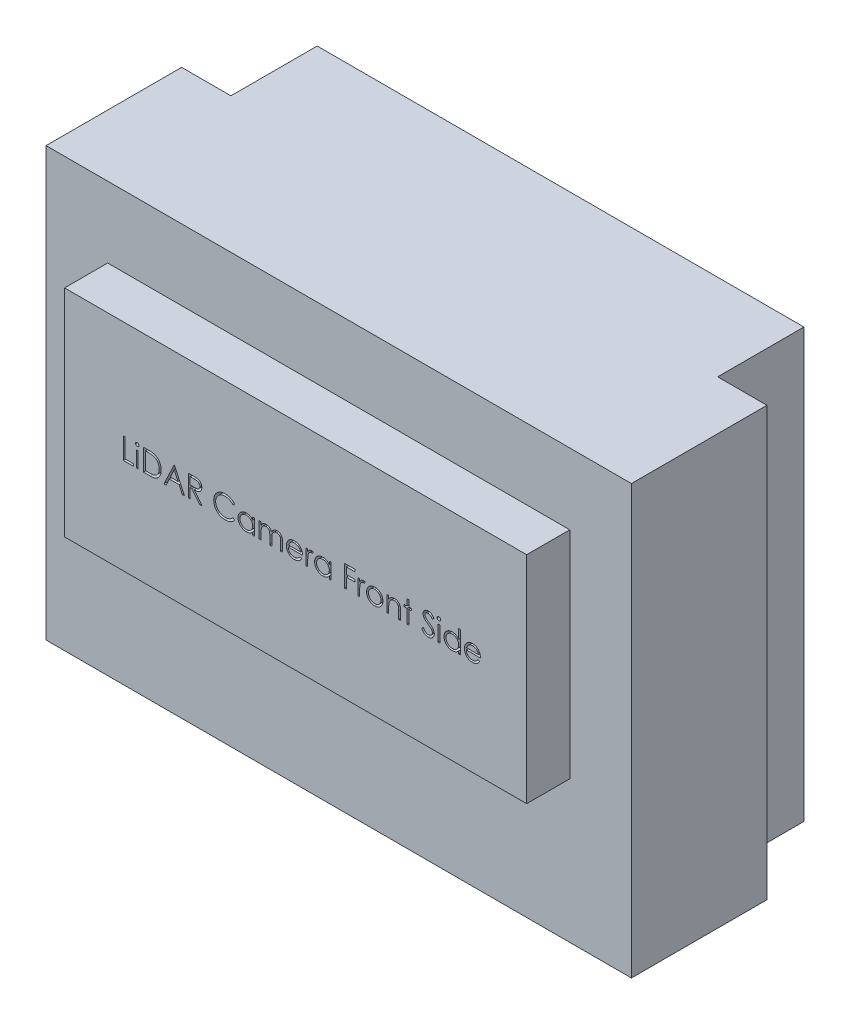
from build123d import *

# Parameters (mm, degrees)
SKETCH1_W            = 95
SKETCH1_H            = 69.5
BODY_DEPTH           = 22
SKETCH2_W            = 75
SKETCH2_H            = 35
CAMERA_POP_OUT_DEPTH = 7
SKETCH3_W            = 79
SKETCH3_H            = 69.5
BACK_SIDE_DEPTH      = 14
TEXT_2_W             = 0.314102564
TEXT_2_H             = 2.557692308
TEXT_2_W_2           = 0.314102565
CUT_EXTRUDE1_DEPTH   = 2


with BuildPart() as part:
    # Sketch1 → Body (new body)
    with BuildSketch(Plane.XY):
        with Locations((47.5, 34.75)):
            Rectangle(SKETCH1_W, SKETCH1_H)
    extrude(amount=BODY_DEPTH)

    # Sketch2 → Camera Pop Out (add)
    with BuildSketch(Plane.XY.offset(22)):
        with Locations((47.5, 40.5)):
            Rectangle(SKETCH2_W, SKETCH2_H)
    extrude(amount=CAMERA_POP_OUT_DEPTH)

    # Sketch3 → back side (add)
    with BuildSketch(Plane(origin=(0, 0, 0), x_dir=(-1, 0, 0), z_dir=(0, 0, -1))):
        with Locations((-47.5, 34.75)):
            Rectangle(SKETCH3_W, SKETCH3_H)
    extrude(amount=BACK_SIDE_DEPTH)

    # Text 2 → Cut-Extrude1 (cut)
    # profile 1 of 22: a face of its own
    with BuildSketch(Plane.XY.offset(29)):
        Polygon((19.535649265, 42.013320355), (19.849751829, 42.013320355), (19.849751829, 38.872294714), (21.195905676, 38.872294714), (21.195905676, 38.513320355), (19.535649265, 38.513320355), align=None)
    # profile 2 of 22: a face of its own
    with BuildSketch(Plane.XY.offset(29)):
        with BuildLine():
            add(Edge.make_bspline(
                [(21.800272663, 42.14793574), (21.819763979, 42.147031588), (21.857931718, 42.145261084), (21.913124986, 42.130099607), (21.963381998, 42.104399921), (22.007959731, 42.06992024), (22.046211618, 42.029370797), (22.072992328, 41.982109828), (22.090204724, 41.93105119), (22.09228328, 41.8954361), (22.093341573, 41.877302727)],
                knots=[0, 0, 0, 0, 1.055194115, 2.066272739, 3.074728998, 4.095836921, 5.109056067, 6.073838105, 7.019297344, 8, 8, 8, 8], degree=3))
            add(Edge.make_bspline(
                [(22.093341573, 41.877302727), (22.092259413, 41.859640074), (22.090120111, 41.824723099), (22.073005623, 41.774549627), (22.045983385, 41.727945343), (22.00798426, 41.687474633), (21.963375499, 41.653014013), (21.913126713, 41.627309274), (21.857931264, 41.612149137), (21.819763825, 41.610378448), (21.800272663, 41.609474202)],
                knots=[0, 0, 0, 0, 0.96129708, 1.900370562, 2.859976407, 3.87933698, 4.906634145, 5.921202961, 6.938410037, 8, 8, 8, 8], degree=3))
            add(Edge.make_bspline(
                [(21.800272663, 41.609474202), (21.781004388, 41.610343922), (21.743501207, 41.612036719), (21.689134365, 41.627606736), (21.639305876, 41.653022809), (21.594641203, 41.687248995), (21.55741101, 41.728193892), (21.530312685, 41.774521186), (21.513237723, 41.82473034), (21.511093094, 41.859642507), (21.51000824, 41.877302727)],
                knots=[0, 0, 0, 0, 1.054934014, 2.053291228, 3.073705704, 4.106921865, 5.123545215, 6.088680038, 7.033164197, 8, 8, 8, 8], degree=3))
            add(Edge.make_bspline(
                [(21.51000824, 41.877302727), (21.511069326, 41.895433577), (21.513153367, 41.931043709), (21.530325484, 41.982138742), (21.557185291, 42.029120244), (21.594665855, 42.070145744), (21.639299315, 42.104391178), (21.68913606, 42.12980216), (21.74350076, 42.145373499), (21.781004236, 42.147066114), (21.800272663, 42.14793574)],
                knots=[0, 0, 0, 0, 0.98631895, 1.937192651, 2.907499808, 3.917963147, 4.944918757, 5.95915025, 6.951458133, 8, 8, 8, 8], degree=3))
        make_face()
    # profile 3 of 22: a face of its own
    with BuildSketch(Plane.XY.offset(29)):
        with Locations((21.801674906, 39.792166509)):
            Rectangle(TEXT_2_W, TEXT_2_H)
    # profile 4 of 22: a face of its own
    with BuildSketch(Plane.XY.offset(29)):
        with BuildLine():
            Line((22.811290291, 38.513320355), (22.811290291, 42.013320355))
            Line((22.811290291, 42.013320355), (23.51802106, 42.013320355))
            add(Edge.make_bspline(
                [(23.51802106, 42.013320355), (23.579490048, 42.012877785), (23.698247814, 42.012022742), (23.869860261, 42.006601351), (24.028644024, 41.997010885), (24.174076883, 41.983041359), (24.306558095, 41.965888326), (24.425716703, 41.944387921), (24.532168846, 41.918999751), (24.597638286, 41.897354301), (24.628597983, 41.887118432)],
                knots=[0, 0, 0, 0, 1.314313732, 2.53924729, 3.670748893, 4.714932338, 5.66265055, 6.526160246, 7.303039223, 8, 8, 8, 8], degree=3))
            add(Edge.make_bspline(
                [(24.628597983, 41.887118432), (24.669092723, 41.871687727), (24.749163915, 41.841176233), (24.863171037, 41.783619931), (24.9704964, 41.71840683), (25.071715545, 41.645450967), (25.164516372, 41.562686618), (25.252524268, 41.473629533), (25.332138992, 41.375041193), (25.405047288, 41.268966205), (25.470782948, 41.156654152), (25.527922106, 41.038319044), (25.575376099, 40.914561836), (25.614769326, 40.785726688), (25.645815783, 40.65153031), (25.666997715, 40.511816444), (25.680968705, 40.367137254), (25.682372756, 40.268962791), (25.683085163, 40.219149682)],
                knots=[0, 0, 0, 0, 0.984719456, 1.947108742, 2.898477687, 3.838006223, 4.779231079, 5.722358779, 6.681677486, 7.655904652, 8.64651281, 9.637519902, 10.640069247, 11.656948941, 12.698408672, 13.768548281, 14.867775369, 16, 16, 16, 16], degree=3))
            add(Edge.make_bspline(
                [(25.683085163, 40.219149682), (25.682456195, 40.175888444), (25.681216749, 40.090637655), (25.670087433, 39.964996759), (25.653911113, 39.843083188), (25.628866915, 39.725477488), (25.598464402, 39.61114927), (25.559500251, 39.501317026), (25.514864755, 39.394973216), (25.462814876, 39.29355574), (25.405673491, 39.197472368), (25.344351748, 39.10689684), (25.278915052, 39.023121618), (25.208739419, 38.945893006), (25.134731703, 38.875327428), (25.056407372, 38.810835412), (24.973564322, 38.753678858), (24.886573599, 38.701611749), (24.79289747, 38.656191394), (24.690761604, 38.617761384), (24.579730426, 38.585914769), (24.460076469, 38.559343873), (24.331592991, 38.53826657), (24.194154025, 38.524140178), (24.047970735, 38.514587245), (23.94759147, 38.513750852), (23.895925708, 38.513320355)],
                knots=[0, 0, 0, 0, 1.105936401, 2.179363191, 3.223086493, 4.248585256, 5.251745608, 6.245858792, 7.225916811, 8.198733463, 9.158002045, 10.082870192, 10.993790845, 11.873723703, 12.748670949, 13.606408763, 14.465103618, 15.319838547, 16.196477973, 17.123216899, 18.106603292, 19.147568657, 20.255746949, 21.433717677, 22.679120308, 24, 24, 24, 24], degree=3))
            Line((23.895925708, 38.513320355), (22.811290291, 38.513320355))
        make_face()
        with BuildLine():
            Line((23.125392855, 38.872294714), (23.527135644, 38.872294714))
            add(Edge.make_bspline(
                [(23.527135644, 38.872294714), (23.584864014, 38.872542811), (23.695896813, 38.873019991), (23.85555481, 38.877207194), (24.001434206, 38.884049132), (24.133555716, 38.893624209), (24.25184474, 38.906292825), (24.35654849, 38.920417727), (24.447323748, 38.938015178), (24.502253185, 38.953966137), (24.527636445, 38.961337182)],
                knots=[0, 0, 0, 0, 1.375205317, 2.645023457, 3.804390687, 4.853969522, 5.800190428, 6.637939096, 7.370582563, 8, 8, 8, 8], degree=3))
            add(Edge.make_bspline(
                [(24.527636445, 38.961337182), (24.559584807, 38.972588741), (24.622718445, 38.994823114), (24.71359953, 39.035380775), (24.798356535, 39.083422845), (24.87846656, 39.136825119), (24.952793216, 39.197471121), (25.022217332, 39.26404211), (25.086599133, 39.336876885), (25.145273441, 39.415885046), (25.197781745, 39.500574842), (25.243252975, 39.590113676), (25.283104506, 39.683520486), (25.314383099, 39.782229644), (25.338898683, 39.885358703), (25.356263371, 39.992914916), (25.367078096, 40.104878198), (25.368339544, 40.181030322), (25.368982599, 40.219850804)],
                knots=[0, 0, 0, 0, 0.998632004, 1.973411704, 2.929992603, 3.868527914, 4.809262121, 5.754881198, 6.702106254, 7.672490631, 8.653608572, 9.636854334, 10.631411391, 11.644891563, 12.686317036, 13.754757253, 14.855430412, 16, 16, 16, 16], degree=3))
            add(Edge.make_bspline(
                [(25.368982599, 40.219850804), (25.368469311, 40.260784284), (25.367460954, 40.341198469), (25.354786643, 40.459189164), (25.336265088, 40.572669815), (25.309481402, 40.68164801), (25.275350523, 40.786336362), (25.232755881, 40.886155872), (25.184089262, 40.982160741), (25.126185925, 41.072135107), (25.062770332, 41.157228216), (24.992392452, 41.235183132), (24.916170414, 41.306177432), (24.834935564, 41.371316745), (24.746398465, 41.427980421), (24.652644774, 41.478667102), (24.552299103, 41.521682993), (24.482486407, 41.544561856), (24.447007438, 41.556188945)],
                knots=[0, 0, 0, 0, 1.122418816, 2.205001699, 3.251619955, 4.274784885, 5.280384055, 6.268708349, 7.249350384, 8.229342522, 9.199999885, 10.157847722, 11.105861043, 12.055065948, 13.010012805, 13.98527497, 14.976112212, 16, 16, 16, 16], degree=3))
            add(Edge.make_bspline(
                [(24.447007438, 41.556188945), (24.417656292, 41.564305373), (24.355247702, 41.581563126), (24.253408238, 41.600388498), (24.138793088, 41.616992997), (24.010893387, 41.631051036), (23.869854928, 41.641138358), (23.71556924, 41.648709672), (23.547969636, 41.653816305), (23.431787102, 41.654165012), (23.371486605, 41.654345996)],
                knots=[0, 0, 0, 0, 0.674548936, 1.434276114, 2.292660221, 3.240891867, 4.284742987, 5.42552168, 6.663806718, 8, 8, 8, 8], degree=3))
            Line((23.371486605, 41.654345996), (23.125392855, 41.654345996))
            Line((23.125392855, 41.654345996), (23.125392855, 38.872294714))
        make_face(mode=Mode.SUBTRACT)
    # profile 5 of 22: a face of its own
    with BuildSketch(Plane.XY.offset(29)):
        Polygon((27.836931317, 42.013320355), (29.452315932, 38.513320355), (29.110869618, 38.513320355), (28.593441733, 39.635115227), (27.006803112, 39.635115227), (26.474651669, 38.513320355), (26.131803112, 38.513320355), (27.792059522, 42.013320355), align=None)
        Polygon((27.81098981, 41.331128849), (27.177175708, 39.994089586), (28.42797699, 39.994089586), align=None, mode=Mode.SUBTRACT)
    # profile 6 of 22: a face of its own
    with BuildSketch(Plane.XY.offset(29)):
        with BuildLine():
            Line((30.08052106, 42.013320355), (30.780941733, 42.013320355))
            add(Edge.make_bspline(
                [(30.780941733, 42.013320355), (30.827682862, 42.013164769), (30.917431006, 42.012866027), (31.046004277, 42.011200264), (31.162831374, 42.006425908), (31.267851213, 42.002317325), (31.361061868, 41.994825384), (31.442749159, 41.987664737), (31.512536856, 41.978291076), (31.554782707, 41.969585653), (31.573910483, 41.965644073)],
                knots=[0, 0, 0, 0, 1.410062039, 2.707475311, 3.878576406, 4.937260626, 5.877586885, 6.699081471, 7.410979367, 8, 8, 8, 8], degree=3))
            add(Edge.make_bspline(
                [(31.573910483, 41.965644073), (31.599517107, 41.959317308), (31.650184097, 41.946798744), (31.723134163, 41.920339144), (31.792648487, 41.889719519), (31.858438311, 41.853755799), (31.920174102, 41.812181019), (31.978492413, 41.765712896), (32.033657877, 41.714605691), (32.083439507, 41.657570849), (32.130378558, 41.59773434), (32.169967185, 41.533030583), (32.204093665, 41.465369055), (32.231264182, 41.394061637), (32.253142155, 41.319799866), (32.268568395, 41.241911069), (32.277819582, 41.160750094), (32.278761438, 41.105392185), (32.279239009, 41.077322759)],
                knots=[0, 0, 0, 0, 1.027469482, 2.033020251, 3.019912614, 3.986113645, 4.951240523, 5.91722682, 6.890402269, 7.87763091, 8.8651537, 9.85103654, 10.82876324, 11.815024772, 12.821070561, 13.842952187, 14.906261191, 16, 16, 16, 16], degree=3))
            add(Edge.make_bspline(
                [(32.279239009, 41.077322759), (32.277770011, 41.030687655), (32.274903615, 40.939690487), (32.248178511, 40.807629605), (32.204401992, 40.684440291), (32.144078703, 40.570277653), (32.067259227, 40.467367007), (31.974934436, 40.376976552), (31.867052824, 40.30133664), (31.766623508, 40.248883835), (31.677909309, 40.215290926), (31.604875996, 40.191654567), (31.525209018, 40.173392602), (31.439671684, 40.15703247), (31.347908028, 40.144680776), (31.250137989, 40.135634181), (31.146291837, 40.129980133), (31.074952768, 40.129138128), (31.038253432, 40.128704971)],
                knots=[0, 0, 0, 0, 1.260483769, 2.459530307, 3.627416485, 4.787058657, 5.939039949, 7.08810263, 8.267026773, 9.491475466, 10.141966685, 10.831826277, 11.566392101, 12.351337768, 13.187381173, 14.07005841, 15.007169909, 16, 16, 16, 16], degree=3))
            Line((31.038253432, 40.128704971), (32.324110804, 38.513320355))
            Line((32.324110804, 38.513320355), (31.935689329, 38.513320355))
            Line((31.935689329, 38.513320355), (30.649831958, 40.128704971))
            Line((30.649831958, 40.128704971), (30.394623624, 40.128704971))
            Line((30.394623624, 40.128704971), (30.394623624, 38.513320355))
            Line((30.394623624, 38.513320355), (30.08052106, 38.513320355))
            Line((30.08052106, 38.513320355), (30.08052106, 42.013320355))
        make_face()
        with BuildLine():
            Line((30.394623624, 41.654345996), (30.394623624, 40.48767933))
            Line((30.394623624, 40.48767933), (31.035448945, 40.482771477))
            add(Edge.make_bspline(
                [(31.035448945, 40.482771477), (31.065368984, 40.482758241), (31.123362541, 40.482732584), (31.207263206, 40.48672636), (31.285383317, 40.491269679), (31.35742407, 40.498219024), (31.423417645, 40.507175096), (31.483331058, 40.51837808), (31.53726211, 40.531430143), (31.600160648, 40.551631769), (31.67039718, 40.583637787), (31.74672864, 40.630203286), (31.811730977, 40.688772405), (31.86664884, 40.755745861), (31.910778271, 40.82938211), (31.941890326, 40.908798479), (31.961632768, 40.991990077), (31.963961313, 41.049168185), (31.965136445, 41.078023881)],
                knots=[0, 0, 0, 0, 1.146690395, 2.22261258, 3.21895312, 4.145990853, 4.996080663, 5.770904154, 6.481378293, 7.121626537, 8.300444488, 9.431385265, 10.535395872, 11.636531494, 12.74115979, 13.810798291, 14.895190096, 16, 16, 16, 16], degree=3))
            add(Edge.make_bspline(
                [(31.965136445, 41.078023881), (31.963934324, 41.106170455), (31.961552158, 41.161946693), (31.94210339, 41.243602604), (31.909214009, 41.320669554), (31.864891771, 41.392834039), (31.810892616, 41.458339775), (31.747574803, 41.514386928), (31.676669608, 41.560636392), (31.610398409, 41.590190773), (31.551164197, 41.608310626), (31.499734537, 41.62106179), (31.441623059, 41.631306259), (31.376547601, 41.63951432), (31.30478597, 41.646569264), (31.225975319, 41.651321043), (31.140638538, 41.654134907), (31.081491607, 41.654273996), (31.050873624, 41.654345996)],
                knots=[0, 0, 0, 0, 1.101028733, 2.181837193, 3.264309656, 4.369019818, 5.486613113, 6.575447106, 7.666700264, 8.788928104, 9.402425223, 10.0903467, 10.862060571, 11.710948788, 12.657782767, 13.684531032, 14.801375019, 16, 16, 16, 16], degree=3))
            Line((31.050873624, 41.654345996), (30.394623624, 41.654345996))
        make_face(mode=Mode.SUBTRACT)
    # profile 7 of 22: a face of its own
    with BuildSketch(Plane.XY.offset(29)):
        with BuildLine():
            Line((37.618982599, 41.371092791), (37.344142855, 41.160756253))
            add(Edge.make_bspline(
                [(37.344142855, 41.160756253), (37.324536967, 41.184122223), (37.28558952, 41.230539138), (37.222930317, 41.295718683), (37.157628674, 41.356783944), (37.089709553, 41.414025824), (37.017950434, 41.46544259), (36.944089635, 41.513713693), (36.86689159, 41.556981431), (36.760139855, 41.609444417), (36.620492007, 41.664190572), (36.444697168, 41.710093803), (36.261186069, 41.739314979), (36.13598847, 41.74247982), (36.072307919, 41.744089586)],
                knots=[0, 0, 0, 0, 0.757959112, 1.505699292, 2.245454638, 2.979532153, 3.711538275, 4.438200793, 5.171680507, 5.909471876, 7.393775596, 8.890124382, 10.418191784, 12, 12, 12, 12], degree=3))
            add(Edge.make_bspline(
                [(36.072307919, 41.744089586), (36.03722462, 41.743685624), (35.967383627, 41.742881448), (35.863735154, 41.732272323), (35.762022103, 41.717361113), (35.662310636, 41.695235789), (35.564727678, 41.66726317), (35.468635276, 41.633837756), (35.375424676, 41.592482916), (35.283806438, 41.546774657), (35.196027227, 41.495147212), (35.112972179, 41.43883386), (35.034944211, 41.378464763), (34.961881599, 41.313813657), (34.893709651, 41.245171697), (34.83092234, 41.171807355), (34.77373693, 41.093955181), (34.721019905, 41.012641774), (34.673807171, 40.928103982), (34.634277292, 40.840028912), (34.59927217, 40.749924809), (34.571572927, 40.656773648), (34.54964841, 40.561230882), (34.534520747, 40.463040094), (34.524032276, 40.362406415), (34.523232099, 40.294197102), (34.522828753, 40.259814746)],
                knots=[0, 0, 0, 0, 1.054917814, 2.100044995, 3.131103042, 4.146048494, 5.169673617, 6.183595914, 7.203665975, 8.234915748, 9.262203917, 10.264457458, 11.251630812, 12.227803204, 13.197192746, 14.159520551, 15.12972552, 16.100847026, 17.073214652, 18.039054194, 19.002613845, 19.979014051, 20.95965708, 21.949030935, 22.966165397, 24, 24, 24, 24], degree=3))
            add(Edge.make_bspline(
                [(34.522828753, 40.259814746), (34.524090572, 40.208083427), (34.526567986, 40.106515842), (34.54861632, 39.957745231), (34.582121411, 39.815224557), (34.632336988, 39.679844715), (34.694256039, 39.549936357), (34.77249665, 39.427697504), (34.863113188, 39.311280939), (34.967387607, 39.203437991), (35.081793423, 39.104924266), (35.204541335, 39.018173684), (35.335325622, 38.945858802), (35.472702253, 38.885682856), (35.617728367, 38.839426128), (35.770143169, 38.806862004), (35.929615164, 38.785619824), (36.038584564, 38.783586136), (36.094042695, 38.782551125)],
                knots=[0, 0, 0, 0, 1.029171465, 2.020641659, 2.987623507, 3.938342917, 4.889210282, 5.84687017, 6.821220943, 7.821438502, 8.827599549, 9.822697543, 10.807740252, 11.797342354, 12.80366471, 13.83203677, 14.896651826, 16, 16, 16, 16], degree=3))
            add(Edge.make_bspline(
                [(36.094042695, 38.782551125), (36.155145384, 38.784239904), (36.275410093, 38.787563827), (36.451778119, 38.815723076), (36.620613885, 38.861380994), (36.781926471, 38.925278916), (36.935261117, 39.008344204), (37.080857778, 39.109042082), (37.218839348, 39.228330414), (37.301810631, 39.319413543), (37.344142855, 39.365884458)],
                knots=[0, 0, 0, 0, 1.028121516, 2.023589091, 2.998037872, 3.967518031, 4.937445131, 5.927275754, 6.942489185, 8, 8, 8, 8], degree=3))
            Line((37.344142855, 39.365884458), (37.618982599, 39.157651285))
            add(Edge.make_bspline(
                [(37.618982599, 39.157651285), (37.596864489, 39.129112833), (37.552734214, 39.072172627), (37.481276197, 38.991900917), (37.405998899, 38.916396881), (37.326343189, 38.84626926), (37.243225398, 38.780114795), (37.155153085, 38.719812963), (37.063284053, 38.664522079), (36.967929574, 38.613895155), (36.869190961, 38.568977908), (36.767186526, 38.53052414), (36.662355951, 38.49739925), (36.554694442, 38.470147314), (36.443978685, 38.44887623), (36.330608211, 38.434656555), (36.214338336, 38.42491464), (36.135896915, 38.424026725), (36.09614606, 38.423576766)],
                knots=[0, 0, 0, 0, 0.986787822, 1.968848986, 2.935600012, 3.899624008, 4.868462664, 5.837806735, 6.815139263, 7.798259679, 8.787526145, 9.778297419, 10.776456485, 11.791383307, 12.812564526, 13.85620153, 14.913611965, 16, 16, 16, 16], degree=3))
            add(Edge.make_bspline(
                [(36.09614606, 38.423576766), (36.058502393, 38.423838758), (35.984066703, 38.424356816), (35.874167951, 38.432748983), (35.767178371, 38.44419872), (35.663403745, 38.461438851), (35.56227777, 38.481783191), (35.464717185, 38.509054448), (35.369761975, 38.539603615), (35.277793634, 38.575508601), (35.188733934, 38.616024784), (35.102870123, 38.661816343), (35.020241691, 38.712498208), (34.94003627, 38.766953218), (34.863438686, 38.82693052), (34.789785161, 38.891597154), (34.718662685, 38.960735165), (34.67466, 39.010590018), (34.652536285, 39.035656093)],
                knots=[0, 0, 0, 0, 1.114604814, 2.203992996, 3.262667896, 4.300477797, 5.318619304, 6.316056647, 7.298880507, 8.271930387, 9.238335007, 10.195173496, 11.151986948, 12.108099108, 13.064862484, 14.031167946, 15.010108607, 16, 16, 16, 16], degree=3))
            add(Edge.make_bspline(
                [(34.652536285, 39.035656093), (34.617100641, 39.079197282), (34.546657164, 39.165753992), (34.456531481, 39.306039973), (34.379383925, 39.452508182), (34.317008005, 39.605928111), (34.268245272, 39.765955498), (34.234464076, 39.932671012), (34.212512472, 40.105918955), (34.210002183, 40.223755743), (34.208726188, 40.283652887)],
                knots=[0, 0, 0, 0, 0.994628077, 1.977248131, 2.950237994, 3.925870899, 4.908910175, 5.911660606, 6.938484602, 8, 8, 8, 8], degree=3))
            add(Edge.make_bspline(
                [(34.208726188, 40.283652887), (34.210281382, 40.346608341), (34.213341128, 40.470469266), (34.239336924, 40.652243219), (34.28115572, 40.826394618), (34.340552608, 40.992598362), (34.41585796, 41.151728643), (34.508884574, 41.302569847), (34.618551716, 41.446086647), (34.743999284, 41.580101398), (34.881566619, 41.702640751), (35.028885433, 41.810446955), (35.18566738, 41.900164471), (35.350185231, 41.975160633), (35.523670913, 42.032805096), (35.705754282, 42.073158283), (35.896093197, 42.098275399), (36.025955622, 42.101450607), (36.091939329, 42.103063945)],
                knots=[0, 0, 0, 0, 1.032925535, 2.032216505, 3.007276963, 3.968222605, 4.92396291, 5.891752235, 6.871517503, 7.883894988, 8.900124299, 9.891468569, 10.874487609, 11.85992873, 12.854644235, 13.869047385, 14.917252991, 16, 16, 16, 16], degree=3))
            add(Edge.make_bspline(
                [(36.091939329, 42.103063945), (36.132153801, 42.102581807), (36.211754299, 42.101627463), (36.329506951, 42.092321321), (36.444149278, 42.076807715), (36.55576026, 42.055691645), (36.664882876, 42.029484323), (36.770683117, 41.995344025), (36.873781804, 41.956307494), (36.973528712, 41.911349028), (37.069445262, 41.860882286), (37.161501581, 41.805466663), (37.24896644, 41.745170857), (37.332455288, 41.680507682), (37.410571499, 41.610109123), (37.485532978, 41.535911527), (37.554794056, 41.455777702), (37.597547251, 41.399372769), (37.618982599, 41.371092791)],
                knots=[0, 0, 0, 0, 1.096760587, 2.17092713, 3.219439832, 4.250915756, 5.268269357, 6.278326846, 7.281116186, 8.274029601, 9.260640565, 10.235837813, 11.203064059, 12.156899882, 13.114053108, 14.069676657, 15.032185724, 16, 16, 16, 16], degree=3))
        make_face()
    # profile 8 of 22: a face of its own
    with BuildSketch(Plane.XY.offset(29)):
        with BuildLine():
            Line((40.849751829, 41.071012663), (40.849751829, 38.513320355))
            Line((40.849751829, 38.513320355), (40.535649265, 38.513320355))
            Line((40.535649265, 38.513320355), (40.535649265, 38.955728208))
            add(Edge.make_bspline(
                [(40.535649265, 38.955728208), (40.500230475, 38.915688614), (40.431110259, 38.837550843), (40.315669141, 38.73546867), (40.193300964, 38.651090349), (40.064599642, 38.582940433), (39.929681399, 38.531748377), (39.788845312, 38.495362218), (39.642033931, 38.471968383), (39.541781576, 38.469632361), (39.490977791, 38.468448561)],
                knots=[0, 0, 0, 0, 1.074387032, 2.096679803, 3.090159297, 4.057316773, 5.018401886, 5.985159533, 6.978961417, 8, 8, 8, 8], degree=3))
            add(Edge.make_bspline(
                [(39.490977791, 38.468448561), (39.445809837, 38.469674933), (39.356736632, 38.472093393), (39.225707555, 38.490855697), (39.099615306, 38.520986318), (38.978340733, 38.562887208), (38.862668588, 38.61846803), (38.751608491, 38.685009278), (38.645735799, 38.764250108), (38.54666426, 38.854838136), (38.45543226, 38.953233123), (38.375370987, 39.05817867), (38.308617907, 39.169220974), (38.252797826, 39.284954128), (38.209801482, 39.406269047), (38.179827848, 39.532746215), (38.161087401, 39.664236089), (38.15866994, 39.753775612), (38.157444137, 39.799177727)],
                knots=[0, 0, 0, 0, 1.033919861, 2.038935746, 3.024066025, 3.998881131, 4.97069526, 5.957263378, 6.95902576, 7.993208707, 9.027059324, 10.027763471, 11.009749337, 11.988697705, 12.965288445, 13.950418724, 14.960734635, 16, 16, 16, 16], degree=3))
            add(Edge.make_bspline(
                [(38.157444137, 39.799177727), (38.158697109, 39.843641431), (38.161174165, 39.931543774), (38.179627385, 40.060822472), (38.210658394, 40.185340733), (38.254206242, 40.304697676), (38.310048196, 40.419037726), (38.377976284, 40.528441751), (38.457995408, 40.633211149), (38.550247815, 40.730882375), (38.650182585, 40.82110299), (38.757091316, 40.899512035), (38.868314598, 40.967228884), (38.985577608, 41.02088236), (39.107144713, 41.064291465), (39.234098159, 41.094324433), (39.365909737, 41.112021754), (39.455400229, 41.114584518), (39.500793496, 41.115884458)],
                knots=[0, 0, 0, 0, 1.020392517, 2.01726096, 2.990465484, 3.961182959, 4.928053699, 5.906110375, 6.912531644, 7.948652711, 8.985773172, 9.998621852, 10.987621588, 11.969261332, 12.953316658, 13.946091881, 14.958173133, 16, 16, 16, 16], degree=3))
            add(Edge.make_bspline(
                [(39.500793496, 41.115884458), (39.552993355, 41.114446706), (39.655354815, 41.111627344), (39.805082824, 41.088164616), (39.946727302, 41.048526149), (40.081381654, 40.994608651), (40.20856234, 40.922959922), (40.327065325, 40.832579961), (40.438130808, 40.724038774), (40.5025111, 40.640668329), (40.535649265, 40.597755452)],
                knots=[0, 0, 0, 0, 1.038897134, 2.037228247, 3.008116434, 3.962042015, 4.918381754, 5.904844433, 6.921570401, 8, 8, 8, 8], degree=3))
            Line((40.535649265, 40.597755452), (40.535649265, 41.071012663))
            Line((40.535649265, 41.071012663), (40.849751829, 41.071012663))
        make_face()
        with BuildLine():
            add(Edge.make_bspline(
                [(39.505000227, 40.801781894), (39.459085889, 40.800148256), (39.368458289, 40.796923715), (39.235414287, 40.77175022), (39.108100873, 40.729865626), (38.987154799, 40.672583724), (38.874486582, 40.600554988), (38.773792911, 40.513433604), (38.68425021, 40.41359659), (38.608941946, 40.30149448), (38.547551449, 40.181316389), (38.504384417, 40.055691951), (38.475915169, 39.926886973), (38.473006649, 39.839524287), (38.471546701, 39.795672118)],
                knots=[0, 0, 0, 0, 1.031046209, 2.035121221, 3.029706178, 4.034933723, 5.034054252, 6.02443088, 7.017295772, 8.038157696, 9.050218397, 10.03989886, 11.016116709, 12, 12, 12, 12], degree=3))
            add(Edge.make_bspline(
                [(38.471546701, 39.795672118), (38.473411595, 39.752082011), (38.477134071, 39.665072655), (38.503884766, 39.536092078), (38.548764639, 39.410438036), (38.610006702, 39.289177043), (38.686693327, 39.176592942), (38.775581979, 39.07485282), (38.877532261, 38.987363232), (38.990459768, 38.914125658), (39.111067738, 38.854963137), (39.23790167, 38.813797498), (39.368577308, 38.787219717), (39.457429642, 38.78411524), (39.50219574, 38.782551125)],
                knots=[0, 0, 0, 0, 0.979072187, 1.954306742, 2.945804271, 3.96968567, 4.997920485, 5.998718438, 6.996577872, 8.005894225, 9.015743152, 10.005417472, 10.995077863, 12, 12, 12, 12], degree=3))
            add(Edge.make_bspline(
                [(39.50219574, 38.782551125), (39.547642242, 38.784211089), (39.638030829, 38.787512592), (39.771469537, 38.812793857), (39.9009645, 38.854562656), (40.024751728, 38.912461783), (40.140067859, 38.984219138), (40.243565737, 39.068226229), (40.331081705, 39.165929414), (40.405274315, 39.273305867), (40.463449731, 39.391017863), (40.505825791, 39.516352054), (40.530879696, 39.649312802), (40.534037426, 39.740176729), (40.535649265, 39.786557535)],
                knots=[0, 0, 0, 0, 1.01762866, 2.023962475, 3.030623092, 4.058876274, 5.077231937, 6.066672613, 7.034107872, 8.005628644, 8.981990164, 9.965428785, 10.961468474, 12, 12, 12, 12], degree=3))
            add(Edge.make_bspline(
                [(40.535649265, 39.786557535), (40.534689609, 39.821895365), (40.532800702, 39.891451399), (40.518370132, 39.993578916), (40.495415206, 40.091312642), (40.463069036, 40.184755331), (40.420577751, 40.273390347), (40.369329985, 40.357854107), (40.308424536, 40.437707318), (40.238841839, 40.511850389), (40.162676637, 40.579476852), (40.082082096, 40.639841092), (39.996103349, 40.689429865), (39.906186312, 40.730471137), (39.812174978, 40.763130286), (39.713304358, 40.78491798), (39.610625371, 40.799878301), (39.540579316, 40.801140682), (39.505000227, 40.801781894)],
                knots=[0, 0, 0, 0, 1.050140795, 2.067009409, 3.05949893, 4.030605086, 5.00011959, 5.97591094, 6.962425594, 7.979863591, 8.993523472, 9.986985069, 10.967611495, 11.937549037, 12.921786183, 13.919465291, 14.943216303, 16, 16, 16, 16], degree=3))
        make_face(mode=Mode.SUBTRACT)
    # profile 9 of 22: a face of its own
    with BuildSketch(Plane.XY.offset(29)):
        with BuildLine():
            Line((41.567700547, 41.071012663), (41.881803112, 41.071012663))
            Line((41.881803112, 41.071012663), (41.881803112, 40.626501445))
            add(Edge.make_bspline(
                [(41.881803112, 40.626501445), (41.910087061, 40.665389047), (41.964281821, 40.73990142), (42.053147474, 40.838091704), (42.141923586, 40.921419859), (42.205856968, 40.96516273), (42.23657074, 40.986176926)],
                knots=[0, 0, 0, 0, 1.134379233, 2.173579362, 3.122582517, 4, 4, 4, 4], degree=3))
            add(Edge.make_bspline(
                [(42.23657074, 40.986176926), (42.278435402, 41.006182291), (42.361433302, 41.045843505), (42.492852527, 41.086077063), (42.627327196, 41.110802165), (42.71813541, 41.114183538), (42.763814329, 41.115884458)],
                knots=[0, 0, 0, 0, 1.014936303, 2.012140481, 3.000054389, 4, 4, 4, 4], degree=3))
            add(Edge.make_bspline(
                [(42.763814329, 41.115884458), (42.794707326, 41.114839167), (42.855842905, 41.112770593), (42.946426995, 41.099310558), (43.034285607, 41.076044385), (43.118899636, 41.043637061), (43.198620316, 41.004390374), (43.271709513, 40.958340666), (43.337333722, 40.906643591), (43.395459773, 40.846964658), (43.447728798, 40.777628059), (43.495807645, 40.69676381), (43.540232857, 40.602556149), (43.564854166, 40.534189608), (43.577816733, 40.498196157)],
                knots=[0, 0, 0, 0, 1.009824226, 1.998387844, 2.986035974, 3.974953746, 4.955485308, 5.885931332, 6.793869504, 7.679848016, 8.601185859, 9.625726857, 10.749998409, 12, 12, 12, 12], degree=3))
            add(Edge.make_bspline(
                [(43.577816733, 40.498196157), (43.591527985, 40.522920576), (43.618509802, 40.571574761), (43.663815439, 40.640433023), (43.711283235, 40.704839815), (43.761317728, 40.764846239), (43.813742315, 40.82015597), (43.868803716, 40.870951871), (43.926188497, 40.917452085), (44.005980737, 40.971775245), (44.109793344, 41.029476426), (44.240681459, 41.07950487), (44.376831631, 41.110420998), (44.469249329, 41.114051271), (44.515917695, 41.115884458)],
                knots=[0, 0, 0, 0, 0.86119277, 1.694706429, 2.50939023, 3.298075842, 4.073795165, 4.829715201, 5.57930267, 6.321991688, 7.768977793, 9.186738141, 10.579381044, 12, 12, 12, 12], degree=3))
            add(Edge.make_bspline(
                [(44.515917695, 41.115884458), (44.558799158, 41.114267237), (44.642722344, 41.111102179), (44.76489961, 41.086248706), (44.878841415, 41.043571058), (44.984318491, 40.985337422), (45.079478304, 40.912158239), (45.162194614, 40.825089401), (45.231964977, 40.724746778), (45.277543617, 40.630354789), (45.308458881, 40.547019456), (45.327520115, 40.476013165), (45.34435981, 40.397861612), (45.358341056, 40.312471351), (45.368559608, 40.219540742), (45.376130323, 40.119221866), (45.381254397, 40.011436755), (45.381616469, 39.937071255), (45.381803112, 39.898737022)],
                knots=[0, 0, 0, 0, 1.209669288, 2.367440248, 3.500751976, 4.631527125, 5.755587489, 6.87532382, 8.007944318, 9.190864318, 9.82315674, 10.514484317, 11.263564316, 12.079023757, 12.955305781, 13.901327259, 14.918167583, 16, 16, 16, 16], degree=3))
            Line((45.381803112, 39.898737022), (45.381803112, 38.513320355))
            Line((45.381803112, 38.513320355), (45.067700547, 38.513320355))
            Line((45.067700547, 38.513320355), (45.067700547, 39.900139266))
            add(Edge.make_bspline(
                [(45.067700547, 39.900139266), (45.067622664, 39.93285984), (45.067472985, 39.995743806), (45.064779354, 40.085996258), (45.05970404, 40.168264615), (45.053769401, 40.242436703), (45.045525591, 40.308685492), (45.03487966, 40.36687791), (45.02360198, 40.417471721), (45.004865989, 40.473557769), (44.974918097, 40.53542798), (44.929300617, 40.602151555), (44.871830511, 40.660232356), (44.805470354, 40.710650672), (44.72992191, 40.751644313), (44.646657186, 40.780920323), (44.556193135, 40.799043202), (44.493570346, 40.800849217), (44.461230195, 40.801781894)],
                knots=[0, 0, 0, 0, 1.253487763, 2.409012846, 3.458416907, 4.410876679, 5.259312806, 6.014470957, 6.676830364, 7.243083969, 8.276244668, 9.299465089, 10.325150304, 11.392391894, 12.482080715, 13.603491619, 14.762376348, 16, 16, 16, 16], degree=3))
            add(Edge.make_bspline(
                [(44.461230195, 40.801781894), (44.42156024, 40.800365736), (44.343157329, 40.797566871), (44.228711843, 40.768992998), (44.118740826, 40.725912747), (44.016525694, 40.66348029), (43.922497903, 40.588671927), (43.841598325, 40.499722331), (43.774766139, 40.399092404), (43.729512164, 40.305945702), (43.700922862, 40.222276258), (43.682045947, 40.149178886), (43.667362555, 40.066097318), (43.653592026, 39.973589827), (43.644604298, 39.871019647), (43.636435926, 39.758861246), (43.632615063, 39.636777286), (43.632080604, 39.552150598), (43.631803112, 39.508212182)],
                knots=[0, 0, 0, 0, 1.090531906, 2.155305635, 3.229839962, 4.33261226, 5.44038871, 6.529323825, 7.629011124, 8.757537029, 9.370236727, 10.061839251, 10.834451254, 11.692844982, 12.636905849, 13.66920014, 14.789842145, 16, 16, 16, 16], degree=3))
            Line((43.631803112, 39.508212182), (43.631803112, 38.513320355))
            Line((43.631803112, 38.513320355), (43.317700547, 38.513320355))
            Line((43.317700547, 38.513320355), (43.317700547, 39.813901285))
            add(Edge.make_bspline(
                [(43.317700547, 39.813901285), (43.317621116, 39.850594604), (43.317468299, 39.921188861), (43.314791982, 40.022422536), (43.30970536, 40.114503616), (43.303824812, 40.19732508), (43.295364633, 40.270736409), (43.285754871, 40.335131167), (43.274406261, 40.390347918), (43.255616376, 40.450911303), (43.226901908, 40.517632226), (43.180713646, 40.588773247), (43.123106065, 40.651041344), (43.05553519, 40.704200093), (42.979529507, 40.748141574), (42.895546107, 40.779801326), (42.804341194, 40.798225616), (42.741463488, 40.800574112), (42.709126829, 40.801781894)],
                knots=[0, 0, 0, 0, 1.320475261, 2.540461679, 3.643808994, 4.639130445, 5.527981419, 6.302341397, 6.981980563, 7.553956391, 8.582137848, 9.585246428, 10.591171744, 11.620968678, 12.668337649, 13.738356861, 14.836885341, 16, 16, 16, 16], degree=3))
            add(Edge.make_bspline(
                [(42.709126829, 40.801781894), (42.671110618, 40.800251434), (42.595345659, 40.797201281), (42.484043689, 40.769747008), (42.376558005, 40.726742933), (42.274603307, 40.667083114), (42.180929158, 40.593184035), (42.098920891, 40.506269139), (42.029978365, 40.407420106), (41.984246551, 40.315255589), (41.954748076, 40.233682314), (41.935152742, 40.164331367), (41.918313116, 40.087331118), (41.905799094, 40.002444007), (41.893718679, 39.910222913), (41.88788837, 39.810208424), (41.882216807, 39.702486336), (41.881944393, 39.628113791), (41.881803112, 39.589542311)],
                knots=[0, 0, 0, 0, 1.098833095, 2.189935336, 3.297829714, 4.440610912, 5.596351641, 6.740013378, 7.886572111, 9.072425424, 9.705826452, 10.395263256, 11.156850408, 11.985370555, 12.878090359, 13.847760091, 14.883794034, 16, 16, 16, 16], degree=3))
            Line((41.881803112, 39.589542311), (41.881803112, 38.513320355))
            Line((41.881803112, 38.513320355), (41.567700547, 38.513320355))
            Line((41.567700547, 38.513320355), (41.567700547, 41.071012663))
        make_face()
    # profile 10 of 22: a face of its own
    with BuildSketch(Plane.XY.offset(29)):
        with BuildLine():
            Line((48.198910483, 39.321012663), (48.477956958, 39.174478208))
            add(Edge.make_bspline(
                [(48.477956958, 39.174478208), (48.455720362, 39.135034877), (48.412456754, 39.058293774), (48.338056006, 38.952861913), (48.260063933, 38.858014198), (48.174959965, 38.776284543), (48.085290287, 38.705033158), (47.990557632, 38.642695334), (47.890268814, 38.589576813), (47.784419089, 38.544824285), (47.672119538, 38.510414791), (47.553098022, 38.48611057), (47.427126526, 38.471087302), (47.340780346, 38.469342161), (47.296566733, 38.468448561)],
                knots=[0, 0, 0, 0, 1.120438281, 2.179929193, 3.190490725, 4.156257408, 5.095198341, 6.022838206, 6.959905092, 7.901321166, 8.864066838, 9.862729781, 10.905609505, 12, 12, 12, 12], degree=3))
            add(Edge.make_bspline(
                [(47.296566733, 38.468448561), (47.247424756, 38.469595736), (47.151562994, 38.471833543), (47.012023247, 38.491126007), (46.880643829, 38.522598366), (46.757432125, 38.566563907), (46.642689873, 38.623991231), (46.536189018, 38.693950713), (46.437369492, 38.776082968), (46.349345283, 38.871099411), (46.2701014, 38.972781369), (46.20017558, 39.078737253), (46.141718149, 39.188700478), (46.094165539, 39.301971002), (46.055760674, 39.417834895), (46.02899397, 39.537346363), (46.013564222, 39.660181947), (46.011199777, 39.743279283), (46.01000824, 39.785155291)],
                knots=[0, 0, 0, 0, 1.145258523, 2.234067595, 3.276747158, 4.290159414, 5.277019952, 6.260822364, 7.254936242, 8.264827045, 9.274100331, 10.257902744, 11.220704747, 12.172965371, 13.118907548, 14.062713208, 15.023725156, 16, 16, 16, 16], degree=3))
            add(Edge.make_bspline(
                [(46.01000824, 39.785155291), (46.011067381, 39.824450122), (46.013166459, 39.902327286), (46.026397247, 40.017592831), (46.04984554, 40.129621283), (46.082021864, 40.238505731), (46.12357311, 40.344063865), (46.174405329, 40.446359929), (46.234597707, 40.545285069), (46.281070381, 40.607688203), (46.304479394, 40.639121637)],
                knots=[0, 0, 0, 0, 1.024358464, 2.0301432, 3.019427413, 4.004406732, 4.986367066, 5.972626655, 6.978780325, 8, 8, 8, 8], degree=3))
            add(Edge.make_bspline(
                [(46.304479394, 40.639121637), (46.336187076, 40.676990508), (46.398598023, 40.751528658), (46.504154378, 40.849466984), (46.618454575, 40.931510759), (46.740066201, 40.999517895), (46.870402675, 41.051191542), (47.007711966, 41.089699124), (47.153557552, 41.111277135), (47.253262773, 41.114324969), (47.304279073, 41.115884458)],
                knots=[0, 0, 0, 0, 1.030682036, 2.02871468, 2.997146059, 3.962720338, 4.930598197, 5.918074684, 6.934738563, 8, 8, 8, 8], degree=3))
            add(Edge.make_bspline(
                [(47.304279073, 41.115884458), (47.356726678, 41.114530409), (47.459616924, 41.111874074), (47.609649045, 41.08724774), (47.751609762, 41.048195186), (47.885442266, 40.993041395), (48.011160127, 40.921881844), (48.127946177, 40.833740002), (48.237797689, 40.731321915), (48.301706268, 40.652558705), (48.33422699, 40.612479009)],
                knots=[0, 0, 0, 0, 1.056321875, 2.072262726, 3.055038591, 4.01806755, 4.982017516, 5.957941055, 6.960871419, 8, 8, 8, 8], degree=3))
            add(Edge.make_bspline(
                [(48.33422699, 40.612479009), (48.356353928, 40.582275428), (48.400460521, 40.522069309), (48.455707621, 40.423898152), (48.503665016, 40.321187558), (48.541997977, 40.212277261), (48.573037478, 40.09845768), (48.595494297, 39.978915136), (48.608663916, 39.853685224), (48.611252613, 39.768358669), (48.612572342, 39.724858817)],
                knots=[0, 0, 0, 0, 0.94817472, 1.890038105, 2.849395472, 3.817997239, 4.812318967, 5.836947057, 6.897266129, 8, 8, 8, 8], degree=3))
            Line((48.612572342, 39.724858817), (46.324110804, 39.724858817))
            add(Edge.make_bspline(
                [(46.324110804, 39.724858817), (46.32565041, 39.691158353), (46.328677984, 39.624887749), (46.342793127, 39.527916966), (46.365041901, 39.435543624), (46.396310964, 39.348460582), (46.434177809, 39.265530454), (46.480563526, 39.187368417), (46.53590308, 39.114330487), (46.597628779, 39.04576335), (46.666335874, 38.984702588), (46.738618622, 38.930050812), (46.815512187, 38.884245215), (46.89641027, 38.847065326), (46.981182055, 38.81795901), (47.06985425, 38.798091189), (47.162252367, 38.784784082), (47.225238101, 38.783304417), (47.257303913, 38.782551125)],
                knots=[0, 0, 0, 0, 1.094153842, 2.151609401, 3.174256925, 4.172055639, 5.149267565, 6.128595816, 7.11444997, 8.118368179, 9.117203808, 10.09244225, 11.054858984, 12.015122123, 12.976791628, 13.957293641, 14.960065497, 16, 16, 16, 16], degree=3))
            add(Edge.make_bspline(
                [(47.257303913, 38.782551125), (47.28865506, 38.783159181), (47.350861751, 38.784365682), (47.443502609, 38.796097593), (47.534642136, 38.815067869), (47.623903119, 38.840957859), (47.709473965, 38.872534711), (47.788719515, 38.910637569), (47.861599731, 38.952787315), (47.929716698, 39.000996991), (47.995787691, 39.060005178), (48.061330177, 39.133640899), (48.131606831, 39.220728426), (48.175596423, 39.286274092), (48.198910483, 39.321012663)],
                knots=[0, 0, 0, 0, 0.99110716, 1.966546729, 2.947904876, 3.932708344, 4.903319531, 5.828989031, 6.710028674, 7.56322171, 8.463672341, 9.504779593, 10.677557249, 12, 12, 12, 12], degree=3))
        make_face()
        with BuildLine():
            add(Edge.make_bspline(
                [(48.298469778, 40.038961381), (48.286973154, 40.080624255), (48.264845852, 40.160811875), (48.218609488, 40.271852766), (48.166537947, 40.370540667), (48.104916216, 40.4561203), (48.03509749, 40.532123813), (47.954452307, 40.598542398), (47.864016414, 40.657959849), (47.764257273, 40.708112349), (47.658615488, 40.750802207), (47.548009296, 40.779427323), (47.435151508, 40.799036865), (47.358817222, 40.800862974), (47.320404874, 40.801781894)],
                knots=[0, 0, 0, 0, 1.154881502, 2.222775134, 3.210006277, 4.132804581, 5.035138423, 5.962687519, 6.919655026, 7.923214229, 8.944639381, 9.960483929, 10.97369054, 12, 12, 12, 12], degree=3))
            add(Edge.make_bspline(
                [(47.320404874, 40.801781894), (47.289055436, 40.801170222), (47.227084187, 40.799961076), (47.135783119, 40.788490947), (47.04810342, 40.769531102), (46.963398132, 40.743566145), (46.882777264, 40.708957543), (46.804582495, 40.668374316), (46.730802099, 40.618832733), (46.684660804, 40.581073878), (46.661350387, 40.56199824)],
                knots=[0, 0, 0, 0, 1.04873581, 2.073130211, 3.073294108, 4.04793562, 5.032784715, 6.005352987, 6.992311501, 8, 8, 8, 8], degree=3))
            add(Edge.make_bspline(
                [(46.661350387, 40.56199824), (46.644657105, 40.546903924), (46.610873971, 40.516356708), (46.565733449, 40.463727502), (46.522512977, 40.40697594), (46.483179324, 40.343930815), (46.447101738, 40.275310036), (46.41334176, 40.201692401), (46.382955348, 40.122519271), (46.365859238, 40.067346831), (46.357063528, 40.038961381)],
                knots=[0, 0, 0, 0, 0.879870761, 1.780643979, 2.707998968, 3.669668524, 4.684282772, 5.740141944, 6.837334558, 8, 8, 8, 8], degree=3))
            Line((46.357063528, 40.038961381), (48.298469778, 40.038961381))
        make_face(mode=Mode.SUBTRACT)
    # profile 11 of 22: a face of its own
    with BuildSketch(Plane.XY.offset(29)):
        with BuildLine():
            Line((49.151033881, 41.071012663), (49.465136445, 41.071012663))
            Line((49.465136445, 41.071012663), (49.465136445, 40.694510259))
            add(Edge.make_bspline(
                [(49.465136445, 40.694510259), (49.488325204, 40.729566088), (49.532673525, 40.796610087), (49.606386454, 40.885279388), (49.681889785, 40.958694434), (49.759544972, 41.017197953), (49.839923072, 41.061011072), (49.921260024, 41.093104107), (50.004835494, 41.112081422), (50.060997418, 41.114615081), (50.089134842, 41.115884458)],
                knots=[0, 0, 0, 0, 1.2804753, 2.448899062, 3.506932113, 4.484331642, 5.4025378, 6.288909075, 7.142734305, 8, 8, 8, 8], degree=3))
            add(Edge.make_bspline(
                [(50.089134842, 41.115884458), (50.110961169, 41.114693931), (50.155870254, 41.112244346), (50.223852844, 41.095033521), (50.293896296, 41.067555498), (50.339038683, 41.041715276), (50.362572342, 41.028244234)],
                knots=[0, 0, 0, 0, 0.901110191, 1.854092781, 2.881294221, 4, 4, 4, 4], degree=3))
            Line((50.362572342, 41.028244234), (50.190096381, 40.756208977))
            add(Edge.make_bspline(
                [(50.190096381, 40.756208977), (50.17498736, 40.762949243), (50.146307545, 40.775743559), (50.104352979, 40.790885569), (50.065671642, 40.799801485), (50.041028084, 40.801152202), (50.02953949, 40.801781894)],
                knots=[0, 0, 0, 0, 1.180555205, 2.24091978, 3.179933427, 4, 4, 4, 4], degree=3))
            add(Edge.make_bspline(
                [(50.02953949, 40.801781894), (50.004333756, 40.800101857), (49.952921366, 40.796675067), (49.877436867, 40.769736259), (49.804189661, 40.726211019), (49.746017999, 40.677939908), (49.700975746, 40.63139211), (49.668835521, 40.590743708), (49.639352774, 40.545165076), (49.611182553, 40.495435392), (49.585516259, 40.440705546), (49.56156159, 40.381522333), (49.539902727, 40.317817204), (49.527552483, 40.273434684), (49.521226188, 40.250700163)],
                knots=[0, 0, 0, 0, 1.125678352, 2.296057538, 3.5422874, 4.923748041, 5.663163013, 6.437101912, 7.23742474, 8.08941207, 8.991984279, 9.93940061, 10.944477711, 12, 12, 12, 12], degree=3))
            add(Edge.make_bspline(
                [(49.521226188, 40.250700163), (49.516493795, 40.23042299), (49.506011903, 40.185510591), (49.495820366, 40.110162066), (49.485750848, 40.021138407), (49.478654229, 39.918191815), (49.472076187, 39.801579371), (49.468366105, 39.671123425), (49.465262964, 39.526690074), (49.465179897, 39.425715721), (49.465136445, 39.372895676)],
                knots=[0, 0, 0, 0, 0.566838948, 1.255505196, 2.06880316, 3.007127437, 4.065329342, 5.249902469, 6.561414163, 8, 8, 8, 8], degree=3))
            Line((49.465136445, 39.372895676), (49.465136445, 38.513320355))
            Line((49.465136445, 38.513320355), (49.151033881, 38.513320355))
            Line((49.151033881, 38.513320355), (49.151033881, 41.071012663))
        make_face()
    # profile 12 of 22: a face of its own
    with BuildSketch(Plane.XY.offset(29)):
        with BuildLine():
            Line((53.279239009, 41.071012663), (53.279239009, 38.513320355))
            Line((53.279239009, 38.513320355), (52.965136445, 38.513320355))
            Line((52.965136445, 38.513320355), (52.965136445, 38.955728208))
            add(Edge.make_bspline(
                [(52.965136445, 38.955728208), (52.929717654, 38.915688614), (52.860597439, 38.837550843), (52.745156321, 38.73546867), (52.622788143, 38.651090349), (52.494086822, 38.582940433), (52.359168579, 38.531748377), (52.218332491, 38.495362218), (52.07152111, 38.471968383), (51.971268756, 38.469632361), (51.92046497, 38.468448561)],
                knots=[0, 0, 0, 0, 1.074387032, 2.096679803, 3.090159297, 4.057316773, 5.018401886, 5.985159533, 6.978961417, 8, 8, 8, 8], degree=3))
            add(Edge.make_bspline(
                [(51.92046497, 38.468448561), (51.875297017, 38.469674933), (51.786223812, 38.472093393), (51.655194735, 38.490855697), (51.529102485, 38.520986318), (51.407827913, 38.562887208), (51.292155767, 38.61846803), (51.18109567, 38.685009278), (51.075222978, 38.764250108), (50.976151439, 38.854838136), (50.884919439, 38.953233123), (50.804858166, 39.05817867), (50.738105087, 39.169220974), (50.682285006, 39.284954128), (50.639288661, 39.406269047), (50.609315027, 39.532746215), (50.59057458, 39.664236089), (50.58815712, 39.753775612), (50.586931317, 39.799177727)],
                knots=[0, 0, 0, 0, 1.033919861, 2.038935746, 3.024066025, 3.998881131, 4.97069526, 5.957263378, 6.95902576, 7.993208707, 9.027059324, 10.027763471, 11.009749337, 11.988697705, 12.965288445, 13.950418724, 14.960734635, 16, 16, 16, 16], degree=3))
            add(Edge.make_bspline(
                [(50.586931317, 39.799177727), (50.588184288, 39.843641431), (50.590661345, 39.931543774), (50.609114565, 40.060822472), (50.640145573, 40.185340733), (50.683693421, 40.304697676), (50.739535376, 40.419037726), (50.807463463, 40.528441751), (50.887482588, 40.633211149), (50.979734995, 40.730882375), (51.079669765, 40.82110299), (51.186578496, 40.899512035), (51.297801777, 40.967228884), (51.415064788, 41.02088236), (51.536631892, 41.064291465), (51.663585338, 41.094324433), (51.795396917, 41.112021754), (51.884887409, 41.114584518), (51.930280676, 41.115884458)],
                knots=[0, 0, 0, 0, 1.020392517, 2.01726096, 2.990465484, 3.961182959, 4.928053699, 5.906110375, 6.912531644, 7.948652711, 8.985773172, 9.998621852, 10.987621588, 11.969261332, 12.953316658, 13.946091881, 14.958173133, 16, 16, 16, 16], degree=3))
            add(Edge.make_bspline(
                [(51.930280676, 41.115884458), (51.982480535, 41.114446706), (52.084841995, 41.111627344), (52.234570004, 41.088164616), (52.376214482, 41.048526149), (52.510868834, 40.994608651), (52.63804952, 40.922959922), (52.756552504, 40.832579961), (52.867617988, 40.724038774), (52.931998279, 40.640668329), (52.965136445, 40.597755452)],
                knots=[0, 0, 0, 0, 1.038897134, 2.037228247, 3.008116434, 3.962042015, 4.918381754, 5.904844433, 6.921570401, 8, 8, 8, 8], degree=3))
            Line((52.965136445, 40.597755452), (52.965136445, 41.071012663))
            Line((52.965136445, 41.071012663), (53.279239009, 41.071012663))
        make_face()
        with BuildLine():
            add(Edge.make_bspline(
                [(51.934487406, 40.801781894), (51.888573069, 40.800148256), (51.797945469, 40.796923715), (51.664901466, 40.77175022), (51.537588052, 40.729865626), (51.416641978, 40.672583724), (51.303973761, 40.600554988), (51.203280091, 40.513433604), (51.113737389, 40.41359659), (51.038429125, 40.30149448), (50.977038628, 40.181316389), (50.933871596, 40.055691951), (50.905402349, 39.926886973), (50.902493828, 39.839524287), (50.901033881, 39.795672118)],
                knots=[0, 0, 0, 0, 1.031046209, 2.035121221, 3.029706178, 4.034933723, 5.034054252, 6.02443088, 7.017295772, 8.038157696, 9.050218397, 10.03989886, 11.016116709, 12, 12, 12, 12], degree=3))
            add(Edge.make_bspline(
                [(50.901033881, 39.795672118), (50.902898774, 39.752082011), (50.906621251, 39.665072655), (50.933371945, 39.536092078), (50.978251819, 39.410438036), (51.039493881, 39.289177043), (51.116180506, 39.176592942), (51.205069159, 39.07485282), (51.30701944, 38.987363232), (51.419946947, 38.914125658), (51.540554918, 38.854963137), (51.667388849, 38.813797498), (51.798064487, 38.787219717), (51.886916821, 38.78411524), (51.931682919, 38.782551125)],
                knots=[0, 0, 0, 0, 0.979072187, 1.954306742, 2.945804271, 3.96968567, 4.997920485, 5.998718438, 6.996577872, 8.005894225, 9.015743152, 10.005417472, 10.995077863, 12, 12, 12, 12], degree=3))
            add(Edge.make_bspline(
                [(51.931682919, 38.782551125), (51.977129422, 38.784211089), (52.067518008, 38.787512592), (52.200956716, 38.812793857), (52.330451679, 38.854562656), (52.454238908, 38.912461783), (52.569555039, 38.984219138), (52.673052916, 39.068226229), (52.760568885, 39.165929414), (52.834761494, 39.273305867), (52.892936911, 39.391017863), (52.93531297, 39.516352054), (52.960366876, 39.649312802), (52.963524606, 39.740176729), (52.965136445, 39.786557535)],
                knots=[0, 0, 0, 0, 1.01762866, 2.023962475, 3.030623092, 4.058876274, 5.077231937, 6.066672613, 7.034107872, 8.005628644, 8.981990164, 9.965428785, 10.961468474, 12, 12, 12, 12], degree=3))
            add(Edge.make_bspline(
                [(52.965136445, 39.786557535), (52.964176788, 39.821895365), (52.962287881, 39.891451399), (52.947857312, 39.993578916), (52.924902385, 40.091312642), (52.892556215, 40.184755331), (52.850064931, 40.273390347), (52.798817165, 40.357854107), (52.737911715, 40.437707318), (52.668329019, 40.511850389), (52.592163816, 40.579476852), (52.511569276, 40.639841092), (52.425590529, 40.689429865), (52.335673492, 40.730471137), (52.241662157, 40.763130286), (52.142791538, 40.78491798), (52.040112551, 40.799878301), (51.970066495, 40.801140682), (51.934487406, 40.801781894)],
                knots=[0, 0, 0, 0, 1.050140795, 2.067009409, 3.05949893, 4.030605086, 5.00011959, 5.97591094, 6.962425594, 7.979863591, 8.993523472, 9.986985069, 10.967611495, 11.937549037, 12.921786183, 13.919465291, 14.943216303, 16, 16, 16, 16], degree=3))
        make_face(mode=Mode.SUBTRACT)
    # profile 13 of 22: a face of its own
    with BuildSketch(Plane.XY.offset(29)):
        Polygon((55.433085163, 42.013320355), (57.138213368, 42.013320355), (57.138213368, 41.654345996), (55.747187727, 41.654345996), (55.747187727, 40.57742292), (57.138213368, 40.57742292), (57.138213368, 40.218448561), (55.747187727, 40.218448561), (55.747187727, 38.513320355), (55.433085163, 38.513320355), align=None)
    # profile 14 of 22: a face of its own
    with BuildSketch(Plane.XY.offset(29)):
        with BuildLine():
            Line((57.586931317, 41.071012663), (57.901033881, 41.071012663))
            Line((57.901033881, 41.071012663), (57.901033881, 40.694510259))
            add(Edge.make_bspline(
                [(57.901033881, 40.694510259), (57.924222639, 40.729566088), (57.96857096, 40.796610087), (58.04228389, 40.885279388), (58.117787221, 40.958694434), (58.195442408, 41.017197953), (58.275820508, 41.061011072), (58.35715746, 41.093104107), (58.44073293, 41.112081422), (58.496894854, 41.114615081), (58.525032278, 41.115884458)],
                knots=[0, 0, 0, 0, 1.2804753, 2.448899062, 3.506932113, 4.484331642, 5.4025378, 6.288909075, 7.142734305, 8, 8, 8, 8], degree=3))
            add(Edge.make_bspline(
                [(58.525032278, 41.115884458), (58.546858605, 41.114693931), (58.59176769, 41.112244346), (58.65975028, 41.095033521), (58.729793732, 41.067555498), (58.774936119, 41.041715276), (58.798469778, 41.028244234)],
                knots=[0, 0, 0, 0, 0.901110191, 1.854092781, 2.881294221, 4, 4, 4, 4], degree=3))
            Line((58.798469778, 41.028244234), (58.625993817, 40.756208977))
            add(Edge.make_bspline(
                [(58.625993817, 40.756208977), (58.610884795, 40.762949243), (58.582204981, 40.775743559), (58.540250415, 40.790885569), (58.501569078, 40.799801485), (58.47692552, 40.801152202), (58.465436926, 40.801781894)],
                knots=[0, 0, 0, 0, 1.180555205, 2.24091978, 3.179933427, 4, 4, 4, 4], degree=3))
            add(Edge.make_bspline(
                [(58.465436926, 40.801781894), (58.440231192, 40.800101857), (58.388818802, 40.796675067), (58.313334303, 40.769736259), (58.240087097, 40.726211019), (58.181915435, 40.677939908), (58.136873182, 40.63139211), (58.104732956, 40.590743708), (58.07525021, 40.545165076), (58.047079989, 40.495435392), (58.021413695, 40.440705546), (57.997459026, 40.381522333), (57.975800163, 40.317817204), (57.963449919, 40.273434684), (57.957123624, 40.250700163)],
                knots=[0, 0, 0, 0, 1.125678352, 2.296057538, 3.5422874, 4.923748041, 5.663163013, 6.437101912, 7.23742474, 8.08941207, 8.991984279, 9.93940061, 10.944477711, 12, 12, 12, 12], degree=3))
            add(Edge.make_bspline(
                [(57.957123624, 40.250700163), (57.952391231, 40.23042299), (57.941909339, 40.185510591), (57.931717801, 40.110162066), (57.921648283, 40.021138407), (57.914551665, 39.918191815), (57.907973623, 39.801579371), (57.904263541, 39.671123425), (57.9011604, 39.526690074), (57.901077333, 39.425715721), (57.901033881, 39.372895676)],
                knots=[0, 0, 0, 0, 0.566838948, 1.255505196, 2.06880316, 3.007127437, 4.065329342, 5.249902469, 6.561414163, 8, 8, 8, 8], degree=3))
            Line((57.901033881, 39.372895676), (57.901033881, 38.513320355))
            Line((57.901033881, 38.513320355), (57.586931317, 38.513320355))
            Line((57.586931317, 38.513320355), (57.586931317, 41.071012663))
        make_face()
    # profile 15 of 22: a face of its own
    with BuildSketch(Plane.XY.offset(29)):
        with BuildLine():
            add(Edge.make_bspline(
                [(60.347948945, 41.115884458), (60.395940218, 41.114862567), (60.490039375, 41.112858888), (60.627847261, 41.091443922), (60.759392397, 41.058696558), (60.885178589, 41.013424996), (61.003594885, 40.952743045), (61.116366129, 40.880333754), (61.223183138, 40.794551161), (61.287206167, 40.728193092), (61.319703753, 40.694510259)],
                knots=[0, 0, 0, 0, 1.054011418, 2.066658804, 3.057071809, 4.030435133, 4.997543892, 5.974964718, 6.972108034, 8, 8, 8, 8], degree=3))
            add(Edge.make_bspline(
                [(61.319703753, 40.694510259), (61.347685707, 40.662296273), (61.403108087, 40.598491731), (61.474173806, 40.495036118), (61.535395366, 40.387896018), (61.584458327, 40.275648691), (61.62314335, 40.15927402), (61.650609047, 40.038372009), (61.666945982, 39.913209662), (61.669148949, 39.828205823), (61.67026465, 39.785155291)],
                knots=[0, 0, 0, 0, 1.025258237, 2.030674902, 3.01204498, 3.988269485, 4.97094183, 5.956517959, 6.965070386, 8, 8, 8, 8], degree=3))
            add(Edge.make_bspline(
                [(61.67026465, 39.785155291), (61.669283313, 39.741855234), (61.667344144, 39.6562923), (61.649000528, 39.530272935), (61.620469442, 39.408078112), (61.579637604, 39.290219418), (61.527279495, 39.176336591), (61.463388807, 39.066927041), (61.38751719, 38.961774908), (61.301513193, 38.86177307), (61.206461317, 38.769606855), (61.103345169, 38.689278586), (60.994191135, 38.620457061), (60.877547782, 38.565020646), (60.754480295, 38.521310945), (60.624723227, 38.490610929), (60.488478156, 38.472049245), (60.395450935, 38.469665672), (60.347948945, 38.468448561)],
                knots=[0, 0, 0, 0, 0.998656419, 1.973391657, 2.932242238, 3.890759089, 4.846373663, 5.82037756, 6.809684879, 7.83454468, 8.860553229, 9.859544525, 10.845671541, 11.83227036, 12.833544569, 13.85385346, 14.904124723, 16, 16, 16, 16], degree=3))
            add(Edge.make_bspline(
                [(60.347948945, 38.468448561), (60.300214225, 38.469669757), (60.206723366, 38.472061531), (60.069997384, 38.490538814), (59.940007765, 38.521296797), (59.816779166, 38.565164289), (59.699634319, 38.620458833), (59.589847822, 38.689070523), (59.486647907, 38.769630678), (59.391575922, 38.861766615), (59.305577317, 38.961776571), (59.229704309, 39.06692661), (59.165813983, 39.176336703), (59.113455779, 39.290219388), (59.072623966, 39.40807812), (59.044092873, 39.530272932), (59.025749259, 39.656292301), (59.02381009, 39.741855234), (59.022828753, 39.785155291)],
                knots=[0, 0, 0, 0, 1.099876186, 2.154163076, 3.173186993, 4.173200201, 5.163417411, 6.152872554, 7.150605724, 8.17532212, 9.198891216, 10.186952605, 11.159729845, 12.11414092, 13.071450619, 14.029093627, 15.002601286, 16, 16, 16, 16], degree=3))
            add(Edge.make_bspline(
                [(59.022828753, 39.785155291), (59.023952063, 39.827971837), (59.026176024, 39.91274124), (59.042496533, 40.0376683), (59.06985509, 40.158365689), (59.108586486, 40.274291165), (59.158101677, 40.386046601), (59.218462965, 40.493451432), (59.290253598, 40.596439233), (59.345455549, 40.660161313), (59.37338965, 40.692406894)],
                knots=[0, 0, 0, 0, 1.031353054, 2.041901799, 3.029428768, 4.008703097, 4.981709435, 5.96992636, 6.972712378, 8, 8, 8, 8], degree=3))
            add(Edge.make_bspline(
                [(59.37338965, 40.692406894), (59.405838241, 40.726381833), (59.469654105, 40.793199529), (59.577002833, 40.878732053), (59.689496654, 40.952648127), (59.80922158, 41.012124343), (59.934904438, 41.05896286), (60.06712368, 41.091528376), (60.205399196, 41.112781731), (60.299958817, 41.114839908), (60.347948945, 41.115884458)],
                knots=[0, 0, 0, 0, 1.027980169, 2.021703884, 2.998553061, 3.971491411, 4.943284454, 5.930300938, 6.949603206, 8, 8, 8, 8], degree=3))
        make_face()
        with BuildLine():
            add(Edge.make_bspline(
                [(60.346546701, 40.801781894), (60.31260909, 40.800817302), (60.245609961, 40.79891302), (60.146990377, 40.784429115), (60.052050223, 40.761481611), (59.960609378, 40.728877555), (59.872976206, 40.686778656), (59.789066804, 40.635070295), (59.708634364, 40.574437339), (59.6332523, 40.504974667), (59.564069988, 40.429095673), (59.503592012, 40.348247314), (59.452166905, 40.263740968), (59.409326746, 40.175488757), (59.377419558, 40.082596343), (59.354246536, 39.986115711), (59.339776295, 39.885850295), (59.337889917, 39.817689277), (59.336931317, 39.783051926)],
                knots=[0, 0, 0, 0, 1.021534396, 2.016698045, 2.994645724, 3.958388632, 4.93408049, 5.916473867, 6.921342795, 7.962252576, 8.998418191, 10.008913653, 10.997312074, 11.973003931, 12.956656626, 13.948281152, 14.957379055, 16, 16, 16, 16], degree=3))
            add(Edge.make_bspline(
                [(59.336931317, 39.783051926), (59.33853814, 39.738299899), (59.341727385, 39.649475493), (59.367662621, 39.518664371), (59.411048901, 39.393082518), (59.469636181, 39.273466132), (59.543042399, 39.162793854), (59.629529466, 39.06412237), (59.728169166, 38.978936559), (59.837785667, 38.908255713), (59.956139985, 38.852095957), (60.081396306, 38.812296982), (60.212037, 38.786425289), (60.301317731, 38.783853815), (60.346546701, 38.782551125)],
                knots=[0, 0, 0, 0, 1.016792936, 2.018143844, 3.017858371, 4.030088057, 5.03801393, 6.028138512, 7.003788237, 7.991172063, 8.984598303, 9.972568034, 10.972917682, 12, 12, 12, 12], degree=3))
            add(Edge.make_bspline(
                [(60.346546701, 38.782551125), (60.39177307, 38.783861405), (60.481048666, 38.786447862), (60.611507843, 38.812166681), (60.736421815, 38.852270342), (60.854653202, 38.908192552), (60.964219806, 38.979204967), (61.063568927, 39.063641344), (61.149317538, 39.163055195), (61.222651143, 39.273612724), (61.282197886, 39.392897076), (61.325381088, 39.518687548), (61.351378674, 39.64946959), (61.354559502, 39.738297921), (61.356162086, 39.783051926)],
                knots=[0, 0, 0, 0, 1.02726834, 2.027799167, 3.010890988, 4.004497153, 4.992059811, 5.971914811, 6.958719428, 7.966827853, 8.981595046, 9.981490638, 10.983022906, 12, 12, 12, 12], degree=3))
            add(Edge.make_bspline(
                [(61.356162086, 39.783051926), (61.355203816, 39.817689484), (61.353318087, 39.885850909), (61.338843122, 39.986113363), (61.315687583, 40.08260496), (61.283715965, 40.175456963), (61.241061952, 40.263969467), (61.188645158, 40.347999194), (61.128414133, 40.42937574), (61.058397012, 40.504729381), (60.983093634, 40.574464418), (60.902628596, 40.635093807), (60.818843618, 40.686551402), (60.731465035, 40.729237643), (60.640012467, 40.761184983), (60.545205338, 40.784561615), (60.447006528, 40.798851812), (60.380247485, 40.800798953), (60.346546701, 40.801781894)],
                knots=[0, 0, 0, 0, 1.042956736, 2.052379634, 3.044323526, 4.02829302, 5.004299113, 5.996692471, 7.007513377, 8.048758398, 9.090003419, 10.095195979, 11.07790575, 12.047570684, 13.018257071, 13.989683339, 14.985167495, 16, 16, 16, 16], degree=3))
        make_face(mode=Mode.SUBTRACT)
    # profile 16 of 22: a face of its own
    with BuildSketch(Plane.XY.offset(29)):
        with BuildLine():
            Line((62.298469778, 41.071012663), (62.612572342, 41.071012663))
            Line((62.612572342, 41.071012663), (62.612572342, 40.609674522))
            add(Edge.make_bspline(
                [(62.612572342, 40.609674522), (62.646109977, 40.651517245), (62.711190928, 40.732714508), (62.819575262, 40.839435083), (62.934119162, 40.927380308), (63.054121166, 40.997484102), (63.179744176, 41.050330728), (63.310222446, 41.088496659), (63.446337152, 41.111381488), (63.538901589, 41.114371718), (63.585729394, 41.115884458)],
                knots=[0, 0, 0, 0, 1.12780773, 2.188550248, 3.19190651, 4.159438251, 5.104880172, 6.052711206, 7.014878035, 8, 8, 8, 8], degree=3))
            add(Edge.make_bspline(
                [(63.585729394, 41.115884458), (63.633060028, 41.114139263), (63.725697495, 41.110723494), (63.860575557, 41.083706803), (63.986548951, 41.037561548), (64.103168506, 40.974349477), (64.20829572, 40.895743004), (64.300620571, 40.804165222), (64.376983819, 40.698829139), (64.428181182, 40.601105983), (64.461906829, 40.514417189), (64.483139167, 40.440170438), (64.501170148, 40.357452287), (64.516801896, 40.266512698), (64.527379008, 40.166714508), (64.5357213, 40.058466816), (64.541699994, 39.941804685), (64.541937201, 39.861118058), (64.542059522, 39.819510259)],
                knots=[0, 0, 0, 0, 1.235846778, 2.418850247, 3.575807741, 4.728682307, 5.871620074, 6.994088408, 8.11269785, 9.256955736, 9.865816715, 10.540099792, 11.271859618, 12.076849838, 12.949306005, 13.892391288, 14.913166135, 16, 16, 16, 16], degree=3))
            Line((64.542059522, 39.819510259), (64.542059522, 38.513320355))
            Line((64.542059522, 38.513320355), (64.227956958, 38.513320355))
            Line((64.227956958, 38.513320355), (64.227956958, 39.716445355))
            add(Edge.make_bspline(
                [(64.227956958, 39.716445355), (64.22776375, 39.7512678), (64.227394176, 39.817877211), (64.226228529, 39.913246234), (64.223418722, 39.999732813), (64.219470409, 40.07713018), (64.213691379, 40.145364017), (64.207668748, 40.204573293), (64.200303771, 40.254682836), (64.193740858, 40.284847918), (64.190797503, 40.298376445)],
                knots=[0, 0, 0, 0, 1.430800155, 2.736877192, 3.918605307, 4.986035426, 5.920637409, 6.731861385, 7.431261377, 8, 8, 8, 8], degree=3))
            add(Edge.make_bspline(
                [(64.190797503, 40.298376445), (64.180171971, 40.33808763), (64.15972111, 40.414519375), (64.109187127, 40.518193727), (64.045372946, 40.606391915), (63.967475097, 40.678568637), (63.876246021, 40.734739474), (63.771938879, 40.773713428), (63.655560238, 40.798089697), (63.573705855, 40.800516829), (63.531041894, 40.801781894)],
                knots=[0, 0, 0, 0, 1.084156227, 2.086665306, 3.027808233, 3.945421172, 4.874247719, 5.839848303, 6.874090471, 8, 8, 8, 8], degree=3))
            add(Edge.make_bspline(
                [(63.531041894, 40.801781894), (63.50577421, 40.801305889), (63.455770117, 40.800363888), (63.381620145, 40.79091259), (63.309695972, 40.775454135), (63.239275763, 40.754585497), (63.171767969, 40.725923228), (63.105003678, 40.693393858), (63.041496914, 40.652845646), (62.979893517, 40.607655024), (62.922580709, 40.557575817), (62.869252371, 40.504731307), (62.82171435, 40.448455703), (62.778645675, 40.389655756), (62.741467412, 40.327523918), (62.709014324, 40.262659611), (62.681478629, 40.194977462), (62.667795936, 40.148002401), (62.660949746, 40.12449824)],
                knots=[0, 0, 0, 0, 1.023777757, 2.026029729, 3.023749952, 4.003683103, 4.997618607, 5.993177895, 7.010360494, 8.046726602, 9.087585522, 10.09234134, 11.086953743, 12.070360549, 13.043493632, 14.017870808, 15.008233677, 16, 16, 16, 16], degree=3))
            add(Edge.make_bspline(
                [(62.660949746, 40.12449824), (62.657010098, 40.107243037), (62.648433689, 40.069679363), (62.639170509, 40.008034943), (62.630762933, 39.936724968), (62.623725975, 39.855832651), (62.619420558, 39.765074776), (62.614726162, 39.664838938), (62.6130171, 39.55472545), (62.612724746, 39.478063757), (62.612572342, 39.438100003)],
                knots=[0, 0, 0, 0, 0.615963638, 1.340920617, 2.168419149, 3.115676021, 4.16674242, 5.331190069, 6.6087489, 8, 8, 8, 8], degree=3))
            Line((62.612572342, 39.438100003), (62.612572342, 38.513320355))
            Line((62.612572342, 38.513320355), (62.298469778, 38.513320355))
            Line((62.298469778, 38.513320355), (62.298469778, 41.071012663))
        make_face()
    # profile 17 of 22: a face of its own
    with BuildSketch(Plane.XY.offset(29)):
        Polygon((65.574110804, 42.103063945), (65.888213368, 42.103063945), (65.888213368, 41.071012663), (66.336931317, 41.071012663), (66.336931317, 40.756910099), (65.888213368, 40.756910099), (65.888213368, 38.513320355), (65.574110804, 38.513320355), (65.574110804, 40.756910099), (65.125392855, 40.756910099), (65.125392855, 41.071012663), (65.574110804, 41.071012663), align=None)
    # profile 18 of 22: a face of its own
    with BuildSketch(Plane.XY.offset(29)):
        with BuildLine():
            Line((67.952315932, 39.188500644), (68.248189329, 39.365884458))
            add(Edge.make_bspline(
                [(68.248189329, 39.365884458), (68.275707567, 39.319820073), (68.328431447, 39.231562489), (68.416382806, 39.112304449), (68.507515718, 39.010942292), (68.602505051, 38.928065684), (68.700770999, 38.862816798), (68.802955053, 38.816614566), (68.908712864, 38.787798591), (68.980686685, 38.784298504), (69.016618817, 38.782551125)],
                knots=[0, 0, 0, 0, 1.272034388, 2.437168799, 3.508375237, 4.49857839, 5.41946034, 6.295179144, 7.148887113, 8, 8, 8, 8], degree=3))
            add(Edge.make_bspline(
                [(69.016618817, 38.782551125), (69.047305677, 38.783405797), (69.10814245, 38.785100187), (69.197704693, 38.801380989), (69.284686495, 38.826393118), (69.367295133, 38.86221405), (69.444390748, 38.905552536), (69.511997443, 38.957898713), (69.570443556, 39.016504919), (69.618252671, 39.081887573), (69.654932706, 39.152204722), (69.683124774, 39.224380673), (69.698769848, 39.299549242), (69.701126602, 39.350159705), (69.702315932, 39.375700163)],
                knots=[0, 0, 0, 0, 1.095163259, 2.171163733, 3.241058638, 4.321873601, 5.38011039, 6.391990106, 7.366004449, 8.327778327, 9.272591725, 10.192022065, 11.087607919, 12, 12, 12, 12], degree=3))
            add(Edge.make_bspline(
                [(69.702315932, 39.375700163), (69.700841621, 39.404841013), (69.697844563, 39.464080102), (69.672513083, 39.551479755), (69.632663836, 39.637972325), (69.595901192, 39.691473591), (69.576815131, 39.719249843)],
                knots=[0, 0, 0, 0, 0.938893495, 1.908633276, 2.914225137, 4, 4, 4, 4], degree=3))
            add(Edge.make_bspline(
                [(69.576815131, 39.719249843), (69.561144517, 39.739296666), (69.528246022, 39.781382465), (69.47168851, 39.8440277), (69.405322395, 39.908646119), (69.33141884, 39.977705176), (69.247285752, 40.047992973), (69.155558237, 40.122861251), (69.053894378, 40.199462828), (68.982594882, 40.250835393), (68.945805515, 40.277342791)],
                knots=[0, 0, 0, 0, 0.722233717, 1.516239348, 2.393582979, 3.351407094, 4.387010283, 5.505090956, 6.712668013, 8, 8, 8, 8], degree=3))
            add(Edge.make_bspline(
                [(68.945805515, 40.277342791), (68.908981519, 40.303571379), (68.838576843, 40.353718441), (68.74011826, 40.428142725), (68.652073797, 40.496186595), (68.574834781, 40.558490607), (68.508435184, 40.615063212), (68.452351773, 40.665361151), (68.408013216, 40.710744712), (68.383357635, 40.740186053), (68.372287887, 40.75340449)],
                knots=[0, 0, 0, 0, 1.452282411, 2.77665338, 3.964542531, 5.026858415, 5.96415736, 6.766646006, 7.446254459, 8, 8, 8, 8], degree=3))
            add(Edge.make_bspline(
                [(68.372287887, 40.75340449), (68.356815342, 40.774005527), (68.326386505, 40.814520231), (68.2862205, 40.877845088), (68.252081337, 40.942668354), (68.225319005, 41.009164218), (68.202782786, 41.076399147), (68.187624855, 41.145250393), (68.178133458, 41.215409011), (68.177161472, 41.262622512), (68.176674906, 41.286257054)],
                knots=[0, 0, 0, 0, 1.068054152, 2.10047183, 3.106115577, 4.101338837, 5.06977816, 6.043150881, 7.020423561, 8, 8, 8, 8], degree=3))
            add(Edge.make_bspline(
                [(68.176674906, 41.286257054), (68.177980115, 41.323286829), (68.180562635, 41.396554892), (68.202403153, 41.503585723), (68.236876046, 41.60577214), (68.285170934, 41.702102474), (68.347428287, 41.790068455), (68.419474262, 41.870681942), (68.505285748, 41.938450524), (68.599438371, 41.997662582), (68.702494743, 42.044008508), (68.810485646, 42.078969488), (68.923582719, 42.098778745), (69.000185853, 42.10162151), (69.039054714, 42.103063945)],
                knots=[0, 0, 0, 0, 1.005424448, 1.989358655, 2.955360095, 3.929531133, 4.905563448, 5.876582895, 6.856512386, 7.866279853, 8.892233794, 9.918561126, 10.94386622, 12, 12, 12, 12], degree=3))
            add(Edge.make_bspline(
                [(69.039054714, 42.103063945), (69.080298814, 42.101641394), (69.162320166, 42.098812392), (69.282969382, 42.074214861), (69.399130098, 42.033514189), (69.492573363, 41.987325531), (69.565706124, 41.941194116), (69.621478857, 41.899174291), (69.677996308, 41.850799183), (69.735714363, 41.795939937), (69.793655022, 41.734093186), (69.852678474, 41.665682497), (69.912922743, 41.591125941), (69.951678603, 41.53790144), (69.971546701, 41.510616028)],
                knots=[0, 0, 0, 0, 1.286793592, 2.559021753, 3.825965368, 5.121522368, 5.803751409, 6.523245864, 7.299691795, 8.125521123, 9.008227632, 9.944561021, 10.946284179, 12, 12, 12, 12], degree=3))
            Line((69.971546701, 41.510616028), (69.687592374, 41.295371637))
            add(Edge.make_bspline(
                [(69.687592374, 41.295371637), (69.670446442, 41.317460328), (69.637427385, 41.359997981), (69.587297898, 41.419569297), (69.54004925, 41.473985776), (69.49349885, 41.521250904), (69.450105219, 41.563953038), (69.407988177, 41.600512794), (69.367753825, 41.63128839), (69.317036915, 41.66413195), (69.253319196, 41.696688453), (69.17333466, 41.724237531), (69.089748385, 41.740792593), (69.032818754, 41.742981481), (69.003998624, 41.744089586)],
                knots=[0, 0, 0, 0, 1.181633172, 2.275549214, 3.290209073, 4.226197932, 5.078386478, 5.862611352, 6.581680152, 7.217281963, 8.414376989, 9.595101626, 10.782541182, 12, 12, 12, 12], degree=3))
            add(Edge.make_bspline(
                [(69.003998624, 41.744089586), (68.967842102, 41.742877886), (68.898117655, 41.740541237), (68.799127418, 41.715021252), (68.710033493, 41.674839391), (68.633480928, 41.618524413), (68.569743951, 41.551803421), (68.523638492, 41.475024566), (68.495888328, 41.390242163), (68.492502048, 41.331100507), (68.49077747, 41.300980612)],
                knots=[0, 0, 0, 0, 1.14458467, 2.207223713, 3.21896685, 4.227309161, 5.202851033, 6.127160689, 7.046193047, 8, 8, 8, 8], degree=3))
            add(Edge.make_bspline(
                [(68.49077747, 41.300980612), (68.491170597, 41.282229133), (68.491957493, 41.244695514), (68.502932291, 41.189244092), (68.51703162, 41.133932752), (68.539374252, 41.07901017), (68.570219555, 41.023515811), (68.610724731, 40.966494073), (68.661738043, 40.907442364), (68.700815056, 40.869034991), (68.721446541, 40.848757054)],
                knots=[0, 0, 0, 0, 0.858281714, 1.717966888, 2.583508476, 3.4729293, 4.427298488, 5.488583878, 6.674047936, 8, 8, 8, 8], degree=3))
            add(Edge.make_bspline(
                [(68.721446541, 40.848757054), (68.729107913, 40.841920028), (68.747309581, 40.82567682), (68.780585506, 40.799084539), (68.824528305, 40.766281767), (68.877990506, 40.725694451), (68.941957867, 40.678612988), (69.016437424, 40.625639376), (69.100598956, 40.565053917), (69.160320872, 40.522696377), (69.191899265, 40.500299522)],
                knots=[0, 0, 0, 0, 0.420754252, 0.999615792, 1.744751191, 2.668019286, 3.750313428, 4.999500688, 6.413464383, 8, 8, 8, 8], degree=3))
            add(Edge.make_bspline(
                [(69.191899265, 40.500299522), (69.229885179, 40.472658163), (69.303439635, 40.419134501), (69.408097215, 40.338718821), (69.502991023, 40.260071052), (69.588454227, 40.183693445), (69.665331135, 40.110165352), (69.732768856, 40.038602172), (69.791454536, 39.969516599), (69.854633755, 39.880944023), (69.919191574, 39.772162939), (69.974633081, 39.638884701), (70.009591429, 39.50508838), (70.014162944, 39.415161544), (70.016418496, 39.370792311)],
                knots=[0, 0, 0, 0, 1.163667725, 2.253281268, 3.268753668, 4.215851969, 5.092017293, 5.902905408, 6.650798638, 7.335211899, 8.59617414, 9.77448103, 10.901945474, 12, 12, 12, 12], degree=3))
            add(Edge.make_bspline(
                [(70.016418496, 39.370792311), (70.015761358, 39.339413945), (70.014459843, 39.277266562), (69.999498929, 39.186011485), (69.977579264, 39.097380615), (69.94454203, 39.012469503), (69.904218872, 38.92972474), (69.853052624, 38.85131684), (69.793744939, 38.775510441), (69.725711174, 38.70432695), (69.651265272, 38.638980754), (69.572581577, 38.580851692), (69.489531304, 38.532383369), (69.402564988, 38.492832527), (69.311662651, 38.461899009), (69.216854867, 38.43948614), (69.117985356, 38.425730429), (69.050784874, 38.424302668), (69.016618817, 38.423576766)],
                knots=[0, 0, 0, 0, 0.983748083, 1.948392443, 2.894712957, 3.844097841, 4.80183111, 5.778335162, 6.776009319, 7.81870978, 8.863265674, 9.881300176, 10.883814829, 11.87499822, 12.874611388, 13.892143829, 14.928324115, 16, 16, 16, 16], degree=3))
            add(Edge.make_bspline(
                [(69.016618817, 38.423576766), (68.990183474, 38.424087947), (68.937645714, 38.425103873), (68.859936232, 38.434085153), (68.783796643, 38.446792257), (68.71018236, 38.466966327), (68.638144949, 38.491443304), (68.567997714, 38.521581636), (68.49970666, 38.557698838), (68.432889078, 38.598993862), (68.367714903, 38.647051607), (68.304795435, 38.703025103), (68.24206625, 38.765370608), (68.181378853, 38.835781172), (68.121505709, 38.913119255), (68.063627299, 38.998108438), (68.006545582, 39.090285792), (67.970730114, 39.155150877), (67.952315932, 39.188500644)],
                knots=[0, 0, 0, 0, 0.915332311, 1.819136955, 2.706846663, 3.586547465, 4.459518054, 5.340707479, 6.227863349, 7.133153174, 8.059268498, 9.028702269, 10.047606654, 11.120612155, 12.245963614, 13.433783089, 14.680604001, 16, 16, 16, 16], degree=3))
        make_face()
    # profile 19 of 22: a face of its own
    with BuildSketch(Plane.XY.offset(29)):
        with BuildLine():
            add(Edge.make_bspline(
                [(70.755400868, 42.14793574), (70.774892184, 42.147031588), (70.813059924, 42.145261084), (70.868253191, 42.130099607), (70.918510203, 42.104399921), (70.963087936, 42.06992024), (71.001339823, 42.029370797), (71.028120533, 41.982109828), (71.045332929, 41.93105119), (71.047411485, 41.8954361), (71.048469778, 41.877302727)],
                knots=[0, 0, 0, 0, 1.055194115, 2.066272739, 3.074728998, 4.095836921, 5.109056067, 6.073838105, 7.019297344, 8, 8, 8, 8], degree=3))
            add(Edge.make_bspline(
                [(71.048469778, 41.877302727), (71.047387618, 41.859640074), (71.045248316, 41.824723099), (71.028133828, 41.774549627), (71.00111159, 41.727945343), (70.963112465, 41.687474633), (70.918503704, 41.653014013), (70.868254918, 41.627309274), (70.813059469, 41.612149137), (70.77489203, 41.610378448), (70.755400868, 41.609474202)],
                knots=[0, 0, 0, 0, 0.96129708, 1.900370562, 2.859976407, 3.87933698, 4.906634145, 5.921202961, 6.938410037, 8, 8, 8, 8], degree=3))
            add(Edge.make_bspline(
                [(70.755400868, 41.609474202), (70.736132593, 41.610343922), (70.698629413, 41.612036719), (70.64426257, 41.627606736), (70.594434081, 41.653022809), (70.549769408, 41.687248995), (70.512539215, 41.728193892), (70.48544089, 41.774521186), (70.468365928, 41.82473034), (70.466221299, 41.859642507), (70.465136445, 41.877302727)],
                knots=[0, 0, 0, 0, 1.054934014, 2.053291228, 3.073705704, 4.106921865, 5.123545215, 6.088680038, 7.033164197, 8, 8, 8, 8], degree=3))
            add(Edge.make_bspline(
                [(70.465136445, 41.877302727), (70.466197531, 41.895433577), (70.468281573, 41.931043709), (70.485453689, 41.982138742), (70.512313496, 42.029120244), (70.54979406, 42.070145744), (70.59442752, 42.104391178), (70.644264265, 42.12980216), (70.698628965, 42.145373499), (70.736132441, 42.147066114), (70.755400868, 42.14793574)],
                knots=[0, 0, 0, 0, 0.98631895, 1.937192651, 2.907499808, 3.917963147, 4.944918757, 5.95915025, 6.951458133, 8, 8, 8, 8], degree=3))
        make_face()
    # profile 20 of 22: a face of its own
    with BuildSketch(Plane.XY.offset(29)):
        with Locations((70.756803112, 39.792166509)):
            Rectangle(TEXT_2_W_2, TEXT_2_H)
    # profile 21 of 22: a face of its own
    with BuildSketch(Plane.XY.offset(29)):
        with BuildLine():
            Line((74.279239009, 42.103063945), (74.279239009, 38.513320355))
            Line((74.279239009, 38.513320355), (73.965136445, 38.513320355))
            Line((73.965136445, 38.513320355), (73.965136445, 38.955728208))
            add(Edge.make_bspline(
                [(73.965136445, 38.955728208), (73.929717654, 38.915688614), (73.860597439, 38.837550843), (73.745156321, 38.73546867), (73.622788143, 38.651090349), (73.494086822, 38.582940433), (73.359168579, 38.531748377), (73.218332491, 38.495362218), (73.07152111, 38.471968383), (72.971268756, 38.469632361), (72.92046497, 38.468448561)],
                knots=[0, 0, 0, 0, 1.074387032, 2.096679803, 3.090159297, 4.057316773, 5.018401886, 5.985159533, 6.978961417, 8, 8, 8, 8], degree=3))
            add(Edge.make_bspline(
                [(72.92046497, 38.468448561), (72.875297017, 38.469674933), (72.786223812, 38.472093393), (72.655194735, 38.490855697), (72.529102485, 38.520986318), (72.407827913, 38.562887208), (72.292155767, 38.61846803), (72.18109567, 38.685009278), (72.075222978, 38.764250108), (71.976151439, 38.854838136), (71.884919439, 38.953233123), (71.804858166, 39.05817867), (71.738105087, 39.169220974), (71.682285006, 39.284954128), (71.639288661, 39.406269047), (71.609315027, 39.532746215), (71.59057458, 39.664236089), (71.58815712, 39.753775612), (71.586931317, 39.799177727)],
                knots=[0, 0, 0, 0, 1.033919861, 2.038935746, 3.024066025, 3.998881131, 4.97069526, 5.957263378, 6.95902576, 7.993208707, 9.027059324, 10.027763471, 11.009749337, 11.988697705, 12.965288445, 13.950418724, 14.960734635, 16, 16, 16, 16], degree=3))
            add(Edge.make_bspline(
                [(71.586931317, 39.799177727), (71.588184288, 39.843641431), (71.590661345, 39.931543774), (71.609114565, 40.060822472), (71.640145573, 40.185340733), (71.683693421, 40.304697676), (71.739535376, 40.419037726), (71.807463463, 40.528441751), (71.887482588, 40.633211149), (71.979734995, 40.730882375), (72.079669765, 40.82110299), (72.186578496, 40.899512035), (72.297801777, 40.967228884), (72.415064788, 41.02088236), (72.536631892, 41.064291465), (72.663585338, 41.094324433), (72.795396917, 41.112021754), (72.884887409, 41.114584518), (72.930280676, 41.115884458)],
                knots=[0, 0, 0, 0, 1.020392517, 2.01726096, 2.990465484, 3.961182959, 4.928053699, 5.906110375, 6.912531644, 7.948652711, 8.985773172, 9.998621852, 10.987621588, 11.969261332, 12.953316658, 13.946091881, 14.958173133, 16, 16, 16, 16], degree=3))
            add(Edge.make_bspline(
                [(72.930280676, 41.115884458), (72.982497483, 41.114317362), (73.084993274, 41.111241327), (73.234891796, 41.08553496), (73.376679406, 41.042372082), (73.511172394, 40.9832808), (73.637568954, 40.906480049), (73.756795594, 40.813728601), (73.866778917, 40.702401455), (73.93185074, 40.618789882), (73.965136445, 40.576020676)],
                knots=[0, 0, 0, 0, 1.031072012, 2.023879775, 2.993683497, 3.952812103, 4.918022106, 5.908088563, 6.929940113, 8, 8, 8, 8], degree=3))
            Line((73.965136445, 40.576020676), (73.965136445, 42.103063945))
            Line((73.965136445, 42.103063945), (74.279239009, 42.103063945))
        make_face()
        with BuildLine():
            add(Edge.make_bspline(
                [(72.934487406, 40.801781894), (72.888573069, 40.800148256), (72.797945469, 40.796923715), (72.664901466, 40.77175022), (72.537588052, 40.729865626), (72.416641978, 40.672583724), (72.303973761, 40.600554988), (72.203280091, 40.513433604), (72.113737389, 40.41359659), (72.038429125, 40.30149448), (71.977038628, 40.181316389), (71.933871596, 40.055691951), (71.905402349, 39.926886973), (71.902493828, 39.839524287), (71.901033881, 39.795672118)],
                knots=[0, 0, 0, 0, 1.031046209, 2.035121221, 3.029706178, 4.034933723, 5.034054252, 6.02443088, 7.017295772, 8.038157696, 9.050218397, 10.03989886, 11.016116709, 12, 12, 12, 12], degree=3))
            add(Edge.make_bspline(
                [(71.901033881, 39.795672118), (71.902898774, 39.752082011), (71.906621251, 39.665072655), (71.933371945, 39.536092078), (71.978251819, 39.410438036), (72.039493881, 39.289177043), (72.116180506, 39.176592942), (72.205069159, 39.07485282), (72.30701944, 38.987363232), (72.419946947, 38.914125658), (72.540554918, 38.854963137), (72.667388849, 38.813797498), (72.798064487, 38.787219717), (72.886916821, 38.78411524), (72.931682919, 38.782551125)],
                knots=[0, 0, 0, 0, 0.979072187, 1.954306742, 2.945804271, 3.96968567, 4.997920485, 5.998718438, 6.996577872, 8.005894225, 9.015743152, 10.005417472, 10.995077863, 12, 12, 12, 12], degree=3))
            add(Edge.make_bspline(
                [(72.931682919, 38.782551125), (72.977129422, 38.784211089), (73.067518008, 38.787512592), (73.200956716, 38.812793857), (73.330451679, 38.854562656), (73.454238908, 38.912461783), (73.569555039, 38.984219138), (73.673052916, 39.068226229), (73.760568885, 39.165929414), (73.834761494, 39.273305867), (73.892936911, 39.391017863), (73.93531297, 39.516352054), (73.960366876, 39.649312802), (73.963524606, 39.740176729), (73.965136445, 39.786557535)],
                knots=[0, 0, 0, 0, 1.01762866, 2.023962475, 3.030623092, 4.058876274, 5.077231937, 6.066672613, 7.034107872, 8.005628644, 8.981990164, 9.965428785, 10.961468474, 12, 12, 12, 12], degree=3))
            add(Edge.make_bspline(
                [(73.965136445, 39.786557535), (73.964176788, 39.821895365), (73.962287881, 39.891451399), (73.947857312, 39.993578916), (73.924902385, 40.091312642), (73.892556215, 40.184755331), (73.850064931, 40.273390347), (73.798817165, 40.357854107), (73.737911715, 40.437707318), (73.668329019, 40.511850389), (73.592163816, 40.579476852), (73.511569276, 40.639841092), (73.425590529, 40.689429865), (73.335673492, 40.730471137), (73.241662157, 40.763130286), (73.142791538, 40.78491798), (73.040112551, 40.799878301), (72.970066495, 40.801140682), (72.934487406, 40.801781894)],
                knots=[0, 0, 0, 0, 1.050140795, 2.067009409, 3.05949893, 4.030605086, 5.00011959, 5.97591094, 6.962425594, 7.979863591, 8.993523472, 9.986985069, 10.967611495, 11.937549037, 12.921786183, 13.919465291, 14.943216303, 16, 16, 16, 16], degree=3))
        make_face(mode=Mode.SUBTRACT)
    # profile 22 of 22: a face of its own
    with BuildSketch(Plane.XY.offset(29)):
        with BuildLine():
            Line((77.096346381, 39.321012663), (77.375392855, 39.174478208))
            add(Edge.make_bspline(
                [(77.375392855, 39.174478208), (77.35315626, 39.135034877), (77.309892651, 39.058293774), (77.235491903, 38.952861913), (77.157499831, 38.858014198), (77.072395863, 38.776284543), (76.982726184, 38.705033158), (76.887993529, 38.642695334), (76.787704711, 38.589576813), (76.681854987, 38.544824285), (76.569555436, 38.510414791), (76.450533919, 38.48611057), (76.324562424, 38.471087302), (76.238216244, 38.469342161), (76.194002631, 38.468448561)],
                knots=[0, 0, 0, 0, 1.120438281, 2.179929193, 3.190490725, 4.156257408, 5.095198341, 6.022838206, 6.959905092, 7.901321166, 8.864066838, 9.862729781, 10.905609505, 12, 12, 12, 12], degree=3))
            add(Edge.make_bspline(
                [(76.194002631, 38.468448561), (76.144860653, 38.469595736), (76.048998892, 38.471833543), (75.909459144, 38.491126007), (75.778079726, 38.522598366), (75.654868023, 38.566563907), (75.54012577, 38.623991231), (75.433624915, 38.693950713), (75.334805389, 38.776082968), (75.24678118, 38.871099411), (75.167537298, 38.972781369), (75.097611478, 39.078737253), (75.039154047, 39.188700478), (74.991601436, 39.301971002), (74.953196571, 39.417834895), (74.926429868, 39.537346363), (74.91100012, 39.660181947), (74.908635674, 39.743279283), (74.907444137, 39.785155291)],
                knots=[0, 0, 0, 0, 1.145258523, 2.234067595, 3.276747158, 4.290159414, 5.277019952, 6.260822364, 7.254936242, 8.264827045, 9.274100331, 10.257902744, 11.220704747, 12.172965371, 13.118907548, 14.062713208, 15.023725156, 16, 16, 16, 16], degree=3))
            add(Edge.make_bspline(
                [(74.907444137, 39.785155291), (74.908503278, 39.824450122), (74.910602357, 39.902327286), (74.923833144, 40.017592831), (74.947281437, 40.129621283), (74.979457761, 40.238505731), (75.021009007, 40.344063865), (75.071841227, 40.446359929), (75.132033604, 40.545285069), (75.178506278, 40.607688203), (75.201915291, 40.639121637)],
                knots=[0, 0, 0, 0, 1.024358464, 2.0301432, 3.019427413, 4.004406732, 4.986367066, 5.972626655, 6.978780325, 8, 8, 8, 8], degree=3))
            add(Edge.make_bspline(
                [(75.201915291, 40.639121637), (75.233622974, 40.676990508), (75.29603392, 40.751528658), (75.401590276, 40.849466984), (75.515890472, 40.931510759), (75.637502098, 40.999517895), (75.767838572, 41.051191542), (75.905147863, 41.089699124), (76.05099345, 41.111277135), (76.15069867, 41.114324969), (76.20171497, 41.115884458)],
                knots=[0, 0, 0, 0, 1.030682036, 2.02871468, 2.997146059, 3.962720338, 4.930598197, 5.918074684, 6.934738563, 8, 8, 8, 8], degree=3))
            add(Edge.make_bspline(
                [(76.20171497, 41.115884458), (76.254162576, 41.114530409), (76.357052822, 41.111874074), (76.507084943, 41.08724774), (76.649045659, 41.048195186), (76.782878164, 40.993041395), (76.908596024, 40.921881844), (77.025382074, 40.833740002), (77.135233586, 40.731321915), (77.199142165, 40.652558705), (77.231662887, 40.612479009)],
                knots=[0, 0, 0, 0, 1.056321875, 2.072262726, 3.055038591, 4.01806755, 4.982017516, 5.957941055, 6.960871419, 8, 8, 8, 8], degree=3))
            add(Edge.make_bspline(
                [(77.231662887, 40.612479009), (77.253789825, 40.582275428), (77.297896419, 40.522069309), (77.353143519, 40.423898152), (77.401100914, 40.321187558), (77.439433875, 40.212277261), (77.470473376, 40.09845768), (77.492930195, 39.978915136), (77.506099813, 39.853685224), (77.50868851, 39.768358669), (77.51000824, 39.724858817)],
                knots=[0, 0, 0, 0, 0.94817472, 1.890038105, 2.849395472, 3.817997239, 4.812318967, 5.836947057, 6.897266129, 8, 8, 8, 8], degree=3))
            Line((77.51000824, 39.724858817), (75.221546701, 39.724858817))
            add(Edge.make_bspline(
                [(75.221546701, 39.724858817), (75.223086308, 39.691158353), (75.226113882, 39.624887749), (75.240229025, 39.527916966), (75.262477799, 39.435543624), (75.293746861, 39.348460582), (75.331613706, 39.265530454), (75.377999423, 39.187368417), (75.433338977, 39.114330487), (75.495064677, 39.04576335), (75.563771772, 38.984702588), (75.636054519, 38.930050812), (75.712948084, 38.884245215), (75.793846168, 38.847065326), (75.878617953, 38.81795901), (75.967290148, 38.798091189), (76.059688264, 38.784784082), (76.122673998, 38.783304417), (76.15473981, 38.782551125)],
                knots=[0, 0, 0, 0, 1.094153842, 2.151609401, 3.174256925, 4.172055639, 5.149267565, 6.128595816, 7.11444997, 8.118368179, 9.117203808, 10.09244225, 11.054858984, 12.015122123, 12.976791628, 13.957293641, 14.960065497, 16, 16, 16, 16], degree=3))
            add(Edge.make_bspline(
                [(76.15473981, 38.782551125), (76.186090958, 38.783159181), (76.248297649, 38.784365682), (76.340938506, 38.796097593), (76.432078034, 38.815067869), (76.521339017, 38.840957859), (76.606909863, 38.872534711), (76.686155413, 38.910637569), (76.759035628, 38.952787315), (76.827152595, 39.000996991), (76.893223588, 39.060005178), (76.958766075, 39.133640899), (77.029042728, 39.220728426), (77.073032321, 39.286274092), (77.096346381, 39.321012663)],
                knots=[0, 0, 0, 0, 0.99110716, 1.966546729, 2.947904876, 3.932708344, 4.903319531, 5.828989031, 6.710028674, 7.56322171, 8.463672341, 9.504779593, 10.677557249, 12, 12, 12, 12], degree=3))
        make_face()
        with BuildLine():
            add(Edge.make_bspline(
                [(77.195905676, 40.038961381), (77.184409051, 40.080624255), (77.16228175, 40.160811875), (77.116045385, 40.271852766), (77.063973844, 40.370540667), (77.002352113, 40.4561203), (76.932533387, 40.532123813), (76.851888205, 40.598542398), (76.761452311, 40.657959849), (76.661693171, 40.708112349), (76.556051386, 40.750802207), (76.445445194, 40.779427323), (76.332587406, 40.799036865), (76.256253119, 40.800862974), (76.217840772, 40.801781894)],
                knots=[0, 0, 0, 0, 1.154881502, 2.222775134, 3.210006277, 4.132804581, 5.035138423, 5.962687519, 6.919655026, 7.923214229, 8.944639381, 9.960483929, 10.97369054, 12, 12, 12, 12], degree=3))
            add(Edge.make_bspline(
                [(76.217840772, 40.801781894), (76.186491333, 40.801170222), (76.124520084, 40.799961076), (76.033219016, 40.788490947), (75.945539317, 40.769531102), (75.860834029, 40.743566145), (75.780213161, 40.708957543), (75.702018393, 40.668374316), (75.628237997, 40.618832733), (75.582096701, 40.581073878), (75.558786285, 40.56199824)],
                knots=[0, 0, 0, 0, 1.04873581, 2.073130211, 3.073294108, 4.04793562, 5.032784715, 6.005352987, 6.992311501, 8, 8, 8, 8], degree=3))
            add(Edge.make_bspline(
                [(75.558786285, 40.56199824), (75.542093003, 40.546903924), (75.508309868, 40.516356708), (75.463169347, 40.463727502), (75.419948874, 40.40697594), (75.380615221, 40.343930815), (75.344537635, 40.275310036), (75.310777658, 40.201692401), (75.280391246, 40.122519271), (75.263295136, 40.067346831), (75.254499426, 40.038961381)],
                knots=[0, 0, 0, 0, 0.879870761, 1.780643979, 2.707998968, 3.669668524, 4.684282772, 5.740141944, 6.837334558, 8, 8, 8, 8], degree=3))
            Line((75.254499426, 40.038961381), (77.195905676, 40.038961381))
        make_face(mode=Mode.SUBTRACT)
    extrude(amount=-CUT_EXTRUDE1_DEPTH, mode=Mode.SUBTRACT)


solid = part.part
